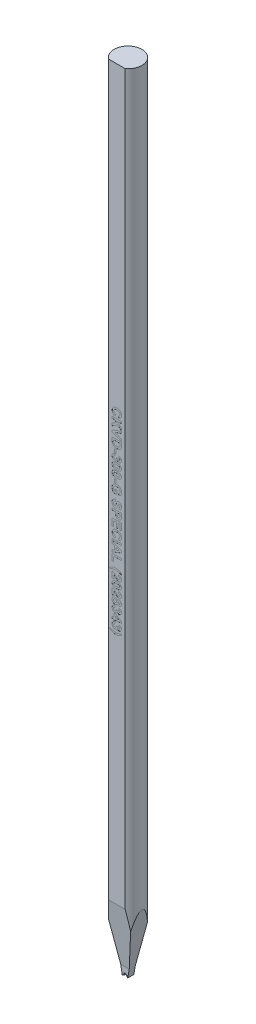
from build123d import *

# Parameters (mm, degrees)
SKETCH_TL_CUTTING_R       = 1.4986
TL_CUTTING_DEPTH          = 85.4964
SKETCH_TDF_GRINDING_W     = 3.0172
SKETCH_TDF_GRINDING_H     = 3.0172
TDF_GRINDING_DEPTH        = 86.522663762
SKETCH_ENGRAVING_W        = 0.166666667
SKETCH_ENGRAVING_H        = 0.371794872
SKETCH_ENGRAVING_W_2      = 1
SKETCH_ENGRAVING_H_2      = 0.192307693
ENGRAVING_DEPTH           = 0.005
VW_VR_GRINDING_DEPTH      = 1.5086
VW_VR_GRINDING_DEPTH_BACK = 1.5086
ISA_GRINDING_DEPTH        = 1.5086
ISA_GRINDING_DEPTH_BACK   = 1.5086
PRE_FRX_BRX_DEPTH         = 1.5086
PRE_FRX_BRX_DEPTH_BACK    = 1.5086
SKETCH_PRE_FRX_BRX_W      = 1.18348
SKETCH_PRE_FRX_BRX_H      = 0.89916
FR_EDM_R                  = 0.14986
BR_EDM_R                  = 0.14986
FA_BA_GRINDING_DEPTH      = 1.5086
FA_BA_GRINDING_DEPTH_BACK = 1.5086


with BuildPart() as part:
    # sketch_TL_cutting → TL_cutting (new body)
    with BuildSketch(Plane(origin=(0, 0, 0), x_dir=(1, 0, 0), z_dir=(0, 1, 0))):
        Circle(SKETCH_TL_CUTTING_R)
    extrude(amount=TL_CUTTING_DEPTH)

    # sketch_TDF_grinding → TDF_grinding (cut, through all)
    with BuildSketch(Plane(origin=(0, 0, 0), x_dir=(1, 0, 0), z_dir=(0, 1, 0))):
        with Locations((0, -2.71002)):
            Rectangle(SKETCH_TDF_GRINDING_W, SKETCH_TDF_GRINDING_H)
    extrude(amount=TDF_GRINDING_DEPTH, mode=Mode.SUBTRACT)

    # sketch_engraving → engraving (cut)
    # profile 1 of 26: a face of its own
    with BuildSketch(Plane.XY.offset(1.20142)):
        with BuildLine():
            Line((-0.128205128, 52.752810256), (-0.192307692, 52.560502564))
            add(Edge.make_bspline(
                [(-0.192307692, 52.560502564), (-0.204917923, 52.564409052), (-0.229612721, 52.572059184), (-0.2649877, 52.586137804), (-0.297871332, 52.602132008), (-0.328259475, 52.619959875), (-0.356049464, 52.639695258), (-0.381471598, 52.661189244), (-0.404368127, 52.684653424), (-0.424673345, 52.710070624), (-0.442633936, 52.737163711), (-0.457816548, 52.766256053), (-0.470893242, 52.79691117), (-0.481488041, 52.829440557), (-0.489972889, 52.863628151), (-0.495577171, 52.899634413), (-0.499377062, 52.937290896), (-0.499789062, 52.963003283), (-0.5, 52.976167628)],
                knots=[0, 0, 0, 0, 1.126670901, 2.206376047, 3.246533763, 4.245677351, 5.210506282, 6.152793389, 7.083980095, 8.004497442, 8.926231833, 9.854395169, 10.801995143, 11.768203916, 12.771938831, 13.805609698, 14.87650608, 16, 16, 16, 16], degree=3))
            add(Edge.make_bspline(
                [(-0.5, 52.976167628), (-0.499663994, 52.992416309), (-0.499003061, 53.024377949), (-0.492350465, 53.071119052), (-0.481969511, 53.115660328), (-0.467601869, 53.158069613), (-0.448555271, 53.198048786), (-0.42571373, 53.235973108), (-0.398318662, 53.271409391), (-0.367249987, 53.304550716), (-0.332452821, 53.334679196), (-0.294134751, 53.360672297), (-0.253074131, 53.383210491), (-0.208709772, 53.401136594), (-0.161353037, 53.415221791), (-0.110975156, 53.425068328), (-0.057578507, 53.431234942), (-0.020984357, 53.431937083), (-0.002203526, 53.432297436)],
                knots=[0, 0, 0, 0, 1.025134988, 2.016471176, 2.973446247, 3.909197306, 4.836872559, 5.763618465, 6.698581235, 7.658772073, 8.627106982, 9.597494692, 10.576422683, 11.578339294, 12.6118974, 13.690673505, 14.814808564, 16, 16, 16, 16], degree=3))
            add(Edge.make_bspline(
                [(-0.002203526, 53.432297436), (0.017576475, 53.4319292), (0.056163648, 53.431210839), (0.112313555, 53.425162878), (0.165084042, 53.415116768), (0.214577853, 53.401540058), (0.260470573, 53.383329249), (0.303160692, 53.361473909), (0.342311169, 53.335356152), (0.377833814, 53.305431091), (0.409480853, 53.272297852), (0.437377469, 53.236593428), (0.460593243, 53.198091041), (0.479896446, 53.157267336), (0.494630503, 53.113823397), (0.505304611, 53.067876602), (0.511505561, 53.019406054), (0.512376199, 52.98626808), (0.512820513, 52.969356731)],
                knots=[0, 0, 0, 0, 1.212773307, 2.365899439, 3.458117515, 4.504331001, 5.50806732, 6.480562534, 7.440239902, 8.387651817, 9.323121479, 10.245404239, 11.160468186, 12.07454208, 13.009500751, 13.96802424, 14.963018902, 16, 16, 16, 16], degree=3))
            add(Edge.make_bspline(
                [(0.512820513, 52.969356731), (0.512448361, 52.954587276), (0.511718707, 52.925629796), (0.506761415, 52.883224506), (0.498061698, 52.843036158), (0.486319015, 52.804847521), (0.470821797, 52.768875987), (0.451884357, 52.735057111), (0.429606892, 52.703274651), (0.412205553, 52.684125065), (0.403445513, 52.674484936)],
                knots=[0, 0, 0, 0, 1.098510076, 2.153775193, 3.169777012, 4.153122333, 5.120892526, 6.076995459, 7.031936742, 8, 8, 8, 8], degree=3))
            add(Edge.make_bspline(
                [(0.403445513, 52.674484936), (0.39787141, 52.668897644), (0.386592274, 52.657591818), (0.367549896, 52.642495368), (0.347050772, 52.628182058), (0.324745215, 52.614879068), (0.30046466, 52.603006849), (0.274581981, 52.591994097), (0.246997406, 52.581855069), (0.227800247, 52.576216604), (0.217948718, 52.573323077)],
                knots=[0, 0, 0, 0, 0.885292881, 1.791380647, 2.722937556, 3.69093542, 4.703306561, 5.754477758, 6.847650944, 8, 8, 8, 8], degree=3))
            Line((0.217948718, 52.573323077), (0.179487179, 52.765630769))
            add(Edge.make_bspline(
                [(0.179487179, 52.765630769), (0.1857949, 52.767265288), (0.198219456, 52.770484861), (0.21607256, 52.77699955), (0.233014714, 52.784471208), (0.248625569, 52.7937361), (0.263619506, 52.803562074), (0.277222328, 52.815224773), (0.290109132, 52.827729754), (0.301694454, 52.841618861), (0.312145605, 52.856493589), (0.321339918, 52.872203983), (0.329014435, 52.888788478), (0.335156827, 52.906121754), (0.340319842, 52.924145702), (0.34350638, 52.943032147), (0.345953545, 52.962615752), (0.3460861, 52.975958875), (0.346153846, 52.982778205)],
                knots=[0, 0, 0, 0, 1.051114734, 2.070420253, 3.064047898, 4.034553068, 4.997066449, 5.953344811, 6.921213386, 7.892675544, 8.867420182, 9.852654213, 10.826683617, 11.811917648, 12.818610352, 13.848120519, 14.900229319, 16, 16, 16, 16], degree=3))
            add(Edge.make_bspline(
                [(0.346153846, 52.982778205), (0.345958725, 52.992142256), (0.345576529, 53.01048423), (0.341532101, 53.03721448), (0.335695112, 53.062655692), (0.326982094, 53.08671706), (0.315677399, 53.109331698), (0.302244603, 53.130828905), (0.286035184, 53.150660806), (0.26758257, 53.169299764), (0.246135655, 53.186007721), (0.221779967, 53.200710652), (0.194212535, 53.212904121), (0.163711493, 53.222804409), (0.130202077, 53.230596736), (0.093641969, 53.236161162), (0.054005962, 53.239238434), (0.026581025, 53.239733903), (0.012419872, 53.239989744)],
                knots=[0, 0, 0, 0, 0.93816214, 1.837638998, 2.704791736, 3.551915875, 4.396257554, 5.235807848, 6.087970119, 6.959042444, 7.860386085, 8.80649345, 9.804409709, 10.875695391, 12.017327537, 13.250155505, 14.580089023, 16, 16, 16, 16], degree=3))
            add(Edge.make_bspline(
                [(0.012419872, 53.239989744), (-0.002609028, 53.239736423), (-0.031567402, 53.239248312), (-0.073337178, 53.236171685), (-0.111754322, 53.230571705), (-0.14688701, 53.222882849), (-0.178713725, 53.212932973), (-0.207179389, 53.200759106), (-0.23231734, 53.186286701), (-0.254110839, 53.169538275), (-0.272831387, 53.150937256), (-0.288926796, 53.130987439), (-0.302688307, 53.109806524), (-0.314010391, 53.087267053), (-0.322575422, 53.063283298), (-0.328786932, 53.038052371), (-0.332735688, 53.011481695), (-0.333131326, 52.993275799), (-0.333333333, 52.983980128)],
                knots=[0, 0, 0, 0, 1.475208372, 2.842499301, 4.107722225, 5.282836115, 6.369007568, 7.375918121, 8.315702116, 9.208439171, 10.065831443, 10.90006451, 11.71996243, 12.54067204, 13.369972975, 14.214060185, 15.088124569, 16, 16, 16, 16], degree=3))
            add(Edge.make_bspline(
                [(-0.333333333, 52.983980128), (-0.333161634, 52.977097953), (-0.332824013, 52.963565176), (-0.330681155, 52.943562689), (-0.326591822, 52.92436438), (-0.321184418, 52.905876281), (-0.314399721, 52.888026559), (-0.305696319, 52.87108748), (-0.295693052, 52.854725777), (-0.283969989, 52.83928094), (-0.270808612, 52.824546156), (-0.255597341, 52.811107159), (-0.238701667, 52.798641373), (-0.220008678, 52.787306947), (-0.199678377, 52.77672516), (-0.177394008, 52.767722121), (-0.153515697, 52.759334984), (-0.136789345, 52.755023153), (-0.128205128, 52.752810256)],
                knots=[0, 0, 0, 0, 0.980177776, 1.927374078, 2.859849964, 3.771585772, 4.668674471, 5.574490016, 6.479656464, 7.396337719, 8.332153134, 9.288470092, 10.28125149, 11.318486971, 12.398724812, 13.541284404, 14.738150009, 16, 16, 16, 16], degree=3))
        make_face()
    # profile 2 of 26: a face of its own
    with BuildSketch(Plane.XY.offset(1.20142)):
        Polygon((-0.5, 52.393835897), (0.5, 52.393835897), (0.5, 52.201528205), (0.052283654, 52.201528205), (0.5, 51.779853526), (0.5, 51.515630769), (0.11338141, 51.895438462), (-0.5, 51.502810256), (-0.5, 51.759020192), (-0.035456731, 52.041271795), (-0.198517628, 52.201528205), (-0.5, 52.201528205), align=None)
    # profile 3 of 26: a face of its own
    with BuildSketch(Plane.XY.offset(1.20142)):
        Polygon((-0.5, 51.126608333), (0.5, 51.4964), (0.5, 51.293275), (-0.243589744, 51.028451282), (0.5, 50.764629167), (0.5, 50.560502564), (-0.5, 50.928891987), align=None)
    # profile 4 of 26: a face of its own
    with BuildSketch(Plane.XY.offset(1.20142)):
        with BuildLine():
            Line((0.5, 50.470758974), (0.5, 50.103972115))
            add(Edge.make_bspline(
                [(0.5, 50.103972115), (0.500005193, 50.093954571), (0.500015306, 50.074448084), (0.498840892, 50.046139066), (0.497659587, 50.019666494), (0.495294873, 49.995106352), (0.492816233, 49.972373432), (0.489678088, 49.951426942), (0.485656212, 49.932399202), (0.482484481, 49.920400319), (0.480969551, 49.914669231)],
                knots=[0, 0, 0, 0, 1.259756885, 2.453039283, 3.563158368, 4.591894114, 5.55549294, 6.43918076, 7.254497783, 8, 8, 8, 8], degree=3))
            add(Edge.make_bspline(
                [(0.480969551, 49.914669231), (0.478637325, 49.907500254), (0.474014881, 49.893291431), (0.465827813, 49.872438378), (0.455960096, 49.852604479), (0.445111978, 49.833329819), (0.432903728, 49.815057553), (0.419595761, 49.797342873), (0.404753223, 49.780709803), (0.383633179, 49.75917514), (0.35420815, 49.734750255), (0.315375005, 49.70891972), (0.272594656, 49.687182014), (0.234409605, 49.671990641), (0.20183843, 49.661946542), (0.175754603, 49.655378141), (0.148301213, 49.649706468), (0.119383738, 49.645456292), (0.08913491, 49.641794906), (0.057465542, 49.639167238), (0.024383276, 49.63786625), (0.001870575, 49.637574494), (-0.009615385, 49.637425641)],
                knots=[0, 0, 0, 0, 0.745431882, 1.477436776, 2.212739876, 2.934276521, 3.663147754, 4.384200836, 5.123377481, 5.865761747, 7.365547505, 8.894711587, 10.468722596, 12.101948761, 12.951987285, 13.837595333, 14.760899389, 15.722756883, 16.726861385, 17.773652936, 18.864119771, 20, 20, 20, 20], degree=3))
            add(Edge.make_bspline(
                [(-0.009615385, 49.637425641), (-0.0294616, 49.637817046), (-0.067834928, 49.63857384), (-0.123301552, 49.644171211), (-0.17465514, 49.653466648), (-0.206804138, 49.663177075), (-0.222355769, 49.667874359)],
                knots=[0, 0, 0, 0, 1.103491527, 2.133638164, 3.0971734, 4, 4, 4, 4], degree=3))
            add(Edge.make_bspline(
                [(-0.222355769, 49.667874359), (-0.231274521, 49.671048003), (-0.248819098, 49.677291057), (-0.274127236, 49.688215932), (-0.298211673, 49.700020337), (-0.321053432, 49.712802184), (-0.342549771, 49.726626052), (-0.362636394, 49.741543645), (-0.381577746, 49.757323731), (-0.393236239, 49.76875549), (-0.399038462, 49.774444872)],
                knots=[0, 0, 0, 0, 1.090884612, 2.145940218, 3.175104604, 4.181306866, 5.161203701, 6.118658341, 7.063689906, 8, 8, 8, 8], degree=3))
            add(Edge.make_bspline(
                [(-0.399038462, 49.774444872), (-0.407300305, 49.783731145), (-0.424264154, 49.802798431), (-0.445652736, 49.83614995), (-0.464086504, 49.874025276), (-0.473760833, 49.901339168), (-0.478766026, 49.915470513)],
                knots=[0, 0, 0, 0, 0.912008655, 1.872605891, 2.89935344, 4, 4, 4, 4], degree=3))
            add(Edge.make_bspline(
                [(-0.478766026, 49.915470513), (-0.4805228, 49.921190486), (-0.484168894, 49.933061996), (-0.488062998, 49.951885444), (-0.492165475, 49.971979947), (-0.49463687, 49.993577223), (-0.497243066, 50.016453081), (-0.498706299, 50.040789822), (-0.49974511, 50.066503081), (-0.499913777, 50.084139175), (-0.5, 50.093154808)],
                knots=[0, 0, 0, 0, 0.799129865, 1.658552685, 2.566799617, 3.538529252, 4.561352959, 5.643373779, 6.795284424, 8, 8, 8, 8], degree=3))
            Line((-0.5, 50.093154808), (-0.5, 50.470758974))
            Line((-0.5, 50.470758974), (0.5, 50.470758974))
        make_face()
        with BuildLine():
            Line((0.333333333, 50.278451282), (-0.333333333, 50.278451282))
            Line((-0.333333333, 50.278451282), (-0.333333333, 50.120198077))
            add(Edge.make_bspline(
                [(-0.333333333, 50.120198077), (-0.333276671, 50.11305336), (-0.333167574, 50.099297049), (-0.332847006, 50.079391316), (-0.331979167, 50.061098115), (-0.331080228, 50.044321614), (-0.329595022, 50.02910549), (-0.328134266, 50.015383535), (-0.326090699, 50.003232132), (-0.324477534, 49.995727127), (-0.323717949, 49.992193269)],
                knots=[0, 0, 0, 0, 1.333384787, 2.567275092, 3.714769766, 4.750907381, 5.701951617, 6.567520054, 7.325492842, 8, 8, 8, 8], degree=3))
            add(Edge.make_bspline(
                [(-0.323717949, 49.992193269), (-0.321509316, 49.983916575), (-0.317207482, 49.967795757), (-0.307617456, 49.945160499), (-0.296048139, 49.924678507), (-0.282136533, 49.90600677), (-0.26455548, 49.88917967), (-0.242070693, 49.874815683), (-0.215254411, 49.861522192), (-0.189584523, 49.852418806), (-0.16665678, 49.845884413), (-0.147412959, 49.841461165), (-0.126593091, 49.837965591), (-0.104279343, 49.834958942), (-0.080500412, 49.832529499), (-0.055170426, 49.831017784), (-0.028320392, 49.829986029), (-0.009883527, 49.829819161), (-0.000400641, 49.829733333)],
                knots=[0, 0, 0, 0, 1.038686998, 2.023088296, 2.974059649, 3.888265163, 4.839857954, 5.909819677, 7.113156087, 8.466843969, 9.20827164, 10.006482943, 10.861893492, 11.769681931, 12.739021491, 13.762258324, 14.849031541, 16, 16, 16, 16], degree=3))
            add(Edge.make_bspline(
                [(-0.000400641, 49.829733333), (0.009082275, 49.8298185), (0.027452469, 49.829983485), (0.054102292, 49.831013664), (0.079033415, 49.832516863), (0.102276578, 49.834963691), (0.123864169, 49.837923456), (0.143813574, 49.841460891), (0.161996804, 49.845854423), (0.183589283, 49.852407511), (0.207947697, 49.862244996), (0.23429421, 49.876071199), (0.2571147, 49.892336402), (0.276689574, 49.910691558), (0.29287817, 49.931778569), (0.306422028, 49.955149371), (0.316938162, 49.981280279), (0.321416742, 49.999869318), (0.323717949, 50.009420833)],
                knots=[0, 0, 0, 0, 1.118059345, 2.165891593, 3.144157881, 4.062285166, 4.920717571, 5.712910489, 6.449981617, 7.12489426, 8.371943983, 9.541298068, 10.624898781, 11.666293176, 12.69306237, 13.747704633, 14.842713931, 16, 16, 16, 16], degree=3))
            add(Edge.make_bspline(
                [(0.323717949, 50.009420833), (0.324486218, 50.013555143), (0.326177652, 50.022657311), (0.328151987, 50.037761571), (0.329628909, 50.055548179), (0.331099472, 50.075977116), (0.331977905, 50.099027064), (0.332859431, 50.124732571), (0.333166326, 50.153116851), (0.333276065, 50.172949207), (0.333333333, 50.183299038)],
                knots=[0, 0, 0, 0, 0.578739524, 1.274162912, 2.095457587, 3.035141998, 4.093102578, 5.270121571, 6.575369351, 8, 8, 8, 8], degree=3))
            Line((0.333333333, 50.183299038), (0.333333333, 50.278451282))
        make_face(mode=Mode.SUBTRACT)
    # profile 5 of 26: a face of its own
    with BuildSketch(Plane.XY.offset(1.20142)):
        with Locations((-0.147435898, 49.310502564)):
            Rectangle(SKETCH_ENGRAVING_W, SKETCH_ENGRAVING_H)
    # profile 6 of 26: a face of its own
    with BuildSketch(Plane.XY.offset(1.20142)):
        with BuildLine():
            Line((-0.215945513, 49.060502564), (-0.192307692, 48.868194872))
            add(Edge.make_bspline(
                [(-0.192307692, 48.868194872), (-0.204132194, 48.866534047), (-0.226576764, 48.863381568), (-0.25764429, 48.853552911), (-0.284674848, 48.840719233), (-0.306838708, 48.823737778), (-0.324372016, 48.80411589), (-0.33711688, 48.78229994), (-0.34490548, 48.758267347), (-0.345732378, 48.741516439), (-0.346153846, 48.732978526)],
                knots=[0, 0, 0, 0, 1.266221457, 2.403466716, 3.446976871, 4.428566981, 5.347951143, 6.225000641, 7.095285456, 8, 8, 8, 8], degree=3))
            add(Edge.make_bspline(
                [(-0.346153846, 48.732978526), (-0.346055611, 48.728363461), (-0.345861023, 48.719221738), (-0.343788926, 48.705789506), (-0.340465357, 48.692918943), (-0.335437029, 48.680731108), (-0.329556159, 48.668986661), (-0.32227181, 48.657736899), (-0.313281658, 48.647422443), (-0.303428531, 48.637359798), (-0.292217285, 48.628428114), (-0.280052259, 48.620560902), (-0.267055651, 48.613654907), (-0.252891939, 48.608302089), (-0.237868043, 48.604112024), (-0.221918716, 48.601116531), (-0.205104086, 48.599293476), (-0.193581061, 48.599075398), (-0.187700321, 48.598964103)],
                knots=[0, 0, 0, 0, 0.951793398, 1.885354025, 2.797928458, 3.688489604, 4.600647717, 5.506538063, 6.445271935, 7.419741996, 8.409776722, 9.395967385, 10.406883209, 11.440832221, 12.514165763, 13.622322902, 14.786559767, 16, 16, 16, 16], degree=3))
            add(Edge.make_bspline(
                [(-0.187700321, 48.598964103), (-0.176786947, 48.599382422), (-0.155968497, 48.600180413), (-0.126418152, 48.606306809), (-0.100528778, 48.617013017), (-0.078485293, 48.631691647), (-0.060832569, 48.649480913), (-0.047691388, 48.669490944), (-0.040013472, 48.691714606), (-0.038982665, 48.707147528), (-0.038461538, 48.714949679)],
                knots=[0, 0, 0, 0, 1.241181749, 2.367689556, 3.413199457, 4.409869786, 5.360751057, 6.245864667, 7.113192516, 8, 8, 8, 8], degree=3))
            add(Edge.make_bspline(
                [(-0.038461538, 48.714949679), (-0.038603641, 48.720503112), (-0.038904883, 48.732275803), (-0.04203482, 48.750587586), (-0.046354275, 48.770556665), (-0.050509304, 48.78415409), (-0.052684295, 48.791271795)],
                knots=[0, 0, 0, 0, 0.854525515, 1.811503923, 2.854410343, 4, 4, 4, 4], degree=3))
            Line((-0.052684295, 48.791271795), (0.102564103, 48.773242949))
            add(Edge.make_bspline(
                [(0.102564103, 48.773242949), (0.102472429, 48.767898846), (0.102294537, 48.757528639), (0.103550083, 48.742385032), (0.10584242, 48.72821013), (0.10956176, 48.715037094), (0.114073964, 48.702853353), (0.119743619, 48.69155343), (0.126797738, 48.681409885), (0.137452935, 48.669074156), (0.153346669, 48.656372172), (0.175381237, 48.645319273), (0.200195104, 48.638563806), (0.217704887, 48.637813684), (0.226762821, 48.637425641)],
                knots=[0, 0, 0, 0, 0.916921599, 1.779281976, 2.604591006, 3.377627834, 4.124827521, 4.832199257, 5.541147775, 6.239830602, 7.625300353, 8.999010263, 10.447566839, 12, 12, 12, 12], degree=3))
            add(Edge.make_bspline(
                [(0.226762821, 48.637425641), (0.234476764, 48.637676334), (0.249283176, 48.638157523), (0.270180788, 48.643395916), (0.288882255, 48.651270608), (0.304586758, 48.662898575), (0.317487731, 48.677054609), (0.326781862, 48.693694939), (0.332438867, 48.712588834), (0.333026806, 48.725859453), (0.333333333, 48.732778205)],
                knots=[0, 0, 0, 0, 1.147344735, 2.202253707, 3.191599761, 4.153119954, 5.090433954, 6.026214277, 6.97094964, 8, 8, 8, 8], degree=3))
            add(Edge.make_bspline(
                [(0.333333333, 48.732778205), (0.332987648, 48.739708214), (0.332308151, 48.753330209), (0.325708071, 48.772798134), (0.315274673, 48.790641507), (0.300599014, 48.806510612), (0.282168696, 48.820209405), (0.259890756, 48.831166627), (0.233746812, 48.838598565), (0.214986903, 48.841191309), (0.205128205, 48.842553846)],
                knots=[0, 0, 0, 0, 0.89036141, 1.750142028, 2.61780756, 3.537452052, 4.514848764, 5.561443886, 6.71849122, 8, 8, 8, 8], degree=3))
            Line((0.205128205, 48.842553846), (0.233974359, 49.034861538))
            add(Edge.make_bspline(
                [(0.233974359, 49.034861538), (0.248657574, 49.031692323), (0.276764536, 49.025625734), (0.316129698, 49.013201503), (0.350961973, 48.998711687), (0.381387831, 48.981441655), (0.408215463, 48.961335814), (0.431647434, 48.93761335), (0.452006068, 48.91028244), (0.469141566, 48.879607941), (0.48286138, 48.846238807), (0.493019554, 48.810730657), (0.49884023, 48.773168376), (0.49960808, 48.747488246), (0.5, 48.734380769)],
                knots=[0, 0, 0, 0, 1.22092895, 2.337131514, 3.351677773, 4.283094182, 5.174661873, 6.069250129, 6.984703325, 7.937694494, 8.918809374, 9.912257166, 10.934388599, 12, 12, 12, 12], degree=3))
            add(Edge.make_bspline(
                [(0.5, 48.734380769), (0.499743324, 48.7232156), (0.499240363, 48.701337211), (0.494922998, 48.669342302), (0.487994845, 48.638986892), (0.478138042, 48.610372682), (0.465473847, 48.583430657), (0.449646388, 48.558407035), (0.431514029, 48.53466228), (0.417247021, 48.520676666), (0.41005609, 48.513627564)],
                knots=[0, 0, 0, 0, 1.090586174, 2.137027055, 3.148380755, 4.128502444, 5.088724121, 6.050075692, 7.017189, 8, 8, 8, 8], degree=3))
            add(Edge.make_bspline(
                [(0.41005609, 48.513627564), (0.403937931, 48.508174347), (0.391853934, 48.497403677), (0.372464834, 48.483452563), (0.352400741, 48.471665213), (0.33177098, 48.462111955), (0.310637907, 48.454351566), (0.288816497, 48.448944728), (0.26639464, 48.445649626), (0.251213033, 48.445295679), (0.243589744, 48.445117949)],
                knots=[0, 0, 0, 0, 1.065686435, 2.104841259, 3.101590809, 4.088754543, 5.058798532, 6.025881737, 7.008716709, 8, 8, 8, 8], degree=3))
            add(Edge.make_bspline(
                [(0.243589744, 48.445117949), (0.232867144, 48.445508156), (0.211730927, 48.446277325), (0.180999661, 48.45338324), (0.151856431, 48.4647029), (0.124562561, 48.480757174), (0.09868881, 48.500990588), (0.075169415, 48.526316452), (0.052695262, 48.555562269), (0.04001359, 48.577565891), (0.033453526, 48.588948077)],
                knots=[0, 0, 0, 0, 0.957658001, 1.887720032, 2.804751961, 3.743912922, 4.709136476, 5.731252806, 6.826406682, 8, 8, 8, 8], degree=3))
            add(Edge.make_bspline(
                [(0.033453526, 48.588948077), (0.031822372, 48.582175609), (0.028603533, 48.568811152), (0.022022537, 48.549514744), (0.01367829, 48.531457672), (0.004232675, 48.514275623), (-0.006542103, 48.498065765), (-0.018789165, 48.482873779), (-0.032819972, 48.469156037), (-0.047679673, 48.456052996), (-0.063887586, 48.444503284), (-0.081022983, 48.434471663), (-0.098866636, 48.425786197), (-0.117582182, 48.418774095), (-0.137087229, 48.413333972), (-0.157475267, 48.409606248), (-0.178623511, 48.407093745), (-0.193034825, 48.406803264), (-0.200320513, 48.40665641)],
                knots=[0, 0, 0, 0, 1.03751577, 2.047382676, 3.031239205, 3.997486026, 4.965932412, 5.927662117, 6.898405035, 7.88572577, 8.876798211, 9.857834218, 10.841137353, 11.829660183, 12.831310853, 13.853692922, 14.91492721, 16, 16, 16, 16], degree=3))
            add(Edge.make_bspline(
                [(-0.200320513, 48.40665641), (-0.2109584, 48.406872661), (-0.231937745, 48.407299137), (-0.2626715, 48.412274881), (-0.292387684, 48.419227328), (-0.320688592, 48.429885264), (-0.348018602, 48.443044593), (-0.373770643, 48.459712865), (-0.398719241, 48.478775045), (-0.421838487, 48.500951285), (-0.443209677, 48.52508231), (-0.461662849, 48.551183574), (-0.477734226, 48.578462651), (-0.490419897, 48.607447217), (-0.500667813, 48.637701873), (-0.507459472, 48.669576996), (-0.512114414, 48.702793455), (-0.512582989, 48.725483302), (-0.512820513, 48.736984936)],
                knots=[0, 0, 0, 0, 1.00633359, 1.984625146, 2.941575753, 3.891818189, 4.841976474, 5.80848851, 6.791183869, 7.810935832, 8.837000052, 9.838854168, 10.83333837, 11.829730352, 12.829487178, 13.852742075, 14.911540725, 16, 16, 16, 16], degree=3))
            add(Edge.make_bspline(
                [(-0.512820513, 48.736984936), (-0.512637793, 48.747883744), (-0.51227889, 48.76929157), (-0.508027091, 48.800630842), (-0.501772194, 48.830646869), (-0.492621954, 48.85916445), (-0.481351422, 48.886431997), (-0.466822586, 48.911934845), (-0.450309361, 48.936329476), (-0.430965435, 48.958818893), (-0.409882535, 48.979729186), (-0.386697234, 48.998096375), (-0.362149526, 49.014463988), (-0.336021778, 49.028541702), (-0.308246096, 49.040211545), (-0.278894175, 49.049298132), (-0.248055897, 49.05654486), (-0.226796469, 49.05916515), (-0.215945513, 49.060502564)],
                knots=[0, 0, 0, 0, 1.077528213, 2.11651914, 3.123276654, 4.10732375, 5.075386463, 6.036572488, 7.005896639, 7.98540975, 8.966414275, 9.939311093, 10.906719916, 11.882103104, 12.870994428, 13.882228509, 14.919075059, 16, 16, 16, 16], degree=3))
        make_face()
    # profile 7 of 26: a face of its own
    with BuildSketch(Plane.XY.offset(1.20142)):
        with BuildLine():
            add(Edge.make_bspline(
                [(0.5, 47.964348718), (0.49971384, 47.952444998), (0.499156721, 47.929269821), (0.494192381, 47.895507508), (0.486315205, 47.863754925), (0.474936732, 47.834005943), (0.460535804, 47.806109267), (0.442472771, 47.780457415), (0.421624591, 47.75645643), (0.405435577, 47.742600797), (0.397235577, 47.735582692)],
                knots=[0, 0, 0, 0, 1.098626248, 2.138899374, 3.143835643, 4.113754749, 5.073488057, 6.034745239, 7.004566348, 8, 8, 8, 8], degree=3))
            add(Edge.make_bspline(
                [(0.397235577, 47.735582692), (0.392013767, 47.731567993), (0.381356969, 47.723374695), (0.364136726, 47.71234029), (0.345869985, 47.701731685), (0.326116385, 47.692473442), (0.305221356, 47.683600078), (0.283126793, 47.675409313), (0.259707844, 47.66817695), (0.235071142, 47.661872124), (0.209179241, 47.655978627), (0.181968999, 47.651041398), (0.15350924, 47.646815972), (0.123831018, 47.643520738), (0.092992495, 47.640566339), (0.060842825, 47.638949757), (0.027454838, 47.637625267), (0.004742429, 47.637492949), (-0.006810897, 47.637425641)],
                knots=[0, 0, 0, 0, 0.746775751, 1.524038446, 2.317840886, 3.141016509, 3.996283186, 4.892488336, 5.812382473, 6.774967264, 7.776368117, 8.823659909, 9.910833035, 11.039122168, 12.210293276, 13.424012874, 14.68964937, 16, 16, 16, 16], degree=3))
            add(Edge.make_bspline(
                [(-0.006810897, 47.637425641), (-0.01836425, 47.637491934), (-0.041009977, 47.637621876), (-0.074330982, 47.638954693), (-0.106413621, 47.640567781), (-0.13725379, 47.643513853), (-0.166926114, 47.646840728), (-0.195353975, 47.650946272), (-0.22243919, 47.656264764), (-0.248289812, 47.662071418), (-0.27303117, 47.668336077), (-0.296407841, 47.6758899), (-0.318777777, 47.683750303), (-0.339699687, 47.692829898), (-0.359477735, 47.702420372), (-0.377930928, 47.712871112), (-0.395257891, 47.724028726), (-0.40597091, 47.732301289), (-0.411258013, 47.736383974)],
                knots=[0, 0, 0, 0, 1.308411734, 2.564617834, 3.776541518, 4.94597967, 6.0725993, 7.15816376, 8.197872509, 9.197791611, 10.158952087, 11.086962723, 11.979249638, 12.843171697, 13.668427753, 14.467630577, 15.243743175, 16, 16, 16, 16], degree=3))
            add(Edge.make_bspline(
                [(-0.411258013, 47.736383974), (-0.419387722, 47.743337875), (-0.435436162, 47.757065209), (-0.456111536, 47.780800465), (-0.473801555, 47.8064109), (-0.487914093, 47.834257064), (-0.499368982, 47.863861236), (-0.506993451, 47.895665546), (-0.511967929, 47.929335616), (-0.512532265, 47.952511213), (-0.512820513, 47.964348718)],
                knots=[0, 0, 0, 0, 0.991667276, 1.957599061, 2.911530233, 3.873218945, 4.847995157, 5.850445929, 6.902062539, 8, 8, 8, 8], degree=3))
            add(Edge.make_bspline(
                [(-0.512820513, 47.964348718), (-0.512476011, 47.976321133), (-0.511800941, 47.999781702), (-0.506449472, 48.034035149), (-0.497876451, 48.066594622), (-0.485636462, 48.097343234), (-0.469774335, 48.126236989), (-0.45076002, 48.153501616), (-0.427732542, 48.178543948), (-0.40629523, 48.198149361), (-0.386925042, 48.212492741), (-0.37086259, 48.222609036), (-0.353675124, 48.232385358), (-0.33482528, 48.240823499), (-0.314870578, 48.249148475), (-0.293380967, 48.256521787), (-0.270541238, 48.263026959), (-0.246455682, 48.269134901), (-0.220958398, 48.274228025), (-0.194124629, 48.278912952), (-0.165840258, 48.282604927), (-0.136262825, 48.285878243), (-0.105322509, 48.288182844), (-0.073069943, 48.290054475), (-0.039401887, 48.290992969), (-0.01649349, 48.291177608), (-0.004807692, 48.291271795)],
                knots=[0, 0, 0, 0, 1.257818097, 2.464759732, 3.634271214, 4.790227596, 5.933394726, 7.09190477, 8.274482889, 9.50191983, 10.139172818, 10.805000628, 11.49619854, 12.215266328, 12.973768034, 13.768328009, 14.601232062, 15.469317089, 16.379095881, 17.333267023, 18.331755967, 19.376479622, 20.460535752, 21.592206075, 22.771760786, 24, 24, 24, 24], degree=3))
            add(Edge.make_bspline(
                [(-0.004807692, 48.291271795), (0.006678925, 48.291206), (0.02919122, 48.291077052), (0.062378132, 48.289734948), (0.094328674, 48.288141634), (0.12509981, 48.28516902), (0.154640959, 48.281869515), (0.183004063, 48.277756894), (0.209982531, 48.272338814), (0.235876189, 48.266989743), (0.260431507, 48.260249782), (0.2837906, 48.252824475), (0.306110518, 48.244990136), (0.326924245, 48.235817854), (0.346659803, 48.226282898), (0.365109758, 48.215824838), (0.382437536, 48.204669066), (0.39315045, 48.196396265), (0.3984375, 48.192313462)],
                knots=[0, 0, 0, 0, 1.304443357, 2.556541329, 3.771813033, 4.936929721, 6.066661712, 7.147723817, 8.190304831, 9.191350322, 10.149780912, 11.080355239, 11.975107155, 12.834450748, 13.66198663, 14.463397305, 15.241653965, 16, 16, 16, 16], degree=3))
            add(Edge.make_bspline(
                [(0.3984375, 48.192313462), (0.406566428, 48.185359179), (0.422613323, 48.171631089), (0.443299998, 48.147901361), (0.460913987, 48.122319209), (0.475197493, 48.094554301), (0.486497465, 48.064882107), (0.494183265, 48.033036121), (0.499144648, 47.999360686), (0.499710816, 47.976185839), (0.5, 47.964348718)],
                knots=[0, 0, 0, 0, 0.991631672, 1.957528776, 2.911425699, 3.867574088, 4.848108326, 5.850523106, 6.902101959, 8, 8, 8, 8], degree=3))
        make_face()
        with BuildLine():
            add(Edge.make_bspline(
                [(0.333333333, 47.964348718), (0.333068079, 47.970516684), (0.332548986, 47.982587158), (0.328316127, 48.000142094), (0.321759633, 48.016723165), (0.312130705, 48.032281206), (0.299093083, 48.04668978), (0.281476094, 48.058897658), (0.259881539, 48.069451162), (0.243736, 48.074730771), (0.235176282, 48.077529808)],
                knots=[0, 0, 0, 0, 0.909107913, 1.77908945, 2.650019014, 3.530482969, 4.465025013, 5.495890128, 6.672421267, 8, 8, 8, 8], degree=3))
            add(Edge.make_bspline(
                [(0.235176282, 48.077529808), (0.228718042, 48.079277997), (0.214837576, 48.083035317), (0.192206647, 48.08729972), (0.166522939, 48.090816485), (0.137792419, 48.093786038), (0.105999886, 48.096202628), (0.071125109, 48.097690848), (0.033192525, 48.098719478), (0.006878451, 48.098880391), (-0.006810897, 48.098964103)],
                knots=[0, 0, 0, 0, 0.658986521, 1.416336438, 2.266694271, 3.212608458, 4.261595115, 5.407496572, 6.651304179, 8, 8, 8, 8], degree=3))
            add(Edge.make_bspline(
                [(-0.006810897, 48.098964103), (-0.020433943, 48.098973117), (-0.046549094, 48.098990397), (-0.084006477, 48.097816163), (-0.118154033, 48.09664872), (-0.148991056, 48.094279061), (-0.176626244, 48.091940892), (-0.200847568, 48.088403343), (-0.221857789, 48.084850608), (-0.244486895, 48.078817153), (-0.268257705, 48.070501394), (-0.292448985, 48.059272977), (-0.311537375, 48.046607058), (-0.325415776, 48.032075587), (-0.334597404, 48.016330329), (-0.341538269, 48.000026395), (-0.345246665, 47.982474555), (-0.345848983, 47.970440013), (-0.346153846, 47.964348718)],
                knots=[0, 0, 0, 0, 1.613038927, 3.092168624, 4.43749063, 5.658264602, 6.75425577, 7.720394221, 8.556328411, 9.275513998, 10.490872946, 11.534172084, 12.42681833, 13.187531851, 13.88996177, 14.574222125, 15.278341114, 16, 16, 16, 16], degree=3))
            add(Edge.make_bspline(
                [(-0.346153846, 47.964348718), (-0.345874419, 47.95825088), (-0.345321688, 47.946188799), (-0.341225408, 47.928656833), (-0.334465655, 47.912099336), (-0.325029126, 47.896436493), (-0.311901617, 47.88201441), (-0.294300445, 47.869797614), (-0.272700888, 47.85924693), (-0.25655611, 47.853966893), (-0.247996795, 47.851167628)],
                knots=[0, 0, 0, 0, 0.899391665, 1.779078861, 2.640979247, 3.529945348, 4.464599804, 5.495588918, 6.672261578, 8, 8, 8, 8], degree=3))
            add(Edge.make_bspline(
                [(-0.247996795, 47.851167628), (-0.241538043, 47.849421968), (-0.227719754, 47.845687186), (-0.205229709, 47.841392396), (-0.179679092, 47.83786611), (-0.151079269, 47.834924791), (-0.11935541, 47.832484431), (-0.084546407, 47.831008845), (-0.046680798, 47.829979247), (-0.020433482, 47.829817356), (-0.006810897, 47.829733333)],
                knots=[0, 0, 0, 0, 0.66114423, 1.414496391, 2.261103113, 3.210114492, 4.255954433, 5.405607896, 6.653488082, 8, 8, 8, 8], degree=3))
            add(Edge.make_bspline(
                [(-0.006810897, 47.829733333), (0.006810741, 47.829847109), (0.032921137, 47.830065199), (0.070464093, 47.830692091), (0.104645163, 47.832447006), (0.13553417, 47.834203226), (0.163028833, 47.837168631), (0.187277888, 47.840111537), (0.208178651, 47.844183667), (0.23096624, 47.849775697), (0.254848985, 47.85811368), (0.278913284, 47.86968584), (0.298191428, 47.88212291), (0.312146257, 47.896629879), (0.321683592, 47.912348044), (0.328364426, 47.928800374), (0.332523972, 47.946249531), (0.333060584, 47.95824941), (0.333333333, 47.964348718)],
                knots=[0, 0, 0, 0, 1.611458614, 3.088895909, 4.441089836, 5.660086535, 6.747875232, 7.711965119, 8.548505902, 9.26500436, 10.486583113, 11.532259092, 12.419544583, 13.184925779, 13.890764661, 14.581638641, 15.279074115, 16, 16, 16, 16], degree=3))
        make_face(mode=Mode.SUBTRACT)
    # profile 8 of 26: a face of its own
    with BuildSketch(Plane.XY.offset(1.20142)):
        with BuildLine():
            add(Edge.make_bspline(
                [(0.5, 47.195117949), (0.49971384, 47.183214229), (0.499156721, 47.160039051), (0.494192381, 47.126276739), (0.486315205, 47.094524156), (0.474936732, 47.064775173), (0.460535804, 47.036878497), (0.442472771, 47.011226646), (0.421624591, 46.987225661), (0.405435577, 46.973370028), (0.397235577, 46.966351923)],
                knots=[0, 0, 0, 0, 1.098626248, 2.138899374, 3.143835643, 4.113754749, 5.073488057, 6.034745239, 7.004566348, 8, 8, 8, 8], degree=3))
            add(Edge.make_bspline(
                [(0.397235577, 46.966351923), (0.392013767, 46.962337224), (0.381356969, 46.954143926), (0.364136726, 46.94310952), (0.345869985, 46.932500915), (0.326116385, 46.923242673), (0.305221356, 46.914369309), (0.283126793, 46.906178544), (0.259707844, 46.89894618), (0.235071142, 46.892641354), (0.209179241, 46.886747858), (0.181968999, 46.881810628), (0.15350924, 46.877585203), (0.123831018, 46.874289969), (0.092992495, 46.87133557), (0.060842825, 46.869718988), (0.027454838, 46.868394498), (0.004742429, 46.868262179), (-0.006810897, 46.868194872)],
                knots=[0, 0, 0, 0, 0.746775751, 1.524038446, 2.317840886, 3.141016509, 3.996283186, 4.892488336, 5.812382473, 6.774967264, 7.776368117, 8.823659909, 9.910833035, 11.039122168, 12.210293276, 13.424012874, 14.68964937, 16, 16, 16, 16], degree=3))
            add(Edge.make_bspline(
                [(-0.006810897, 46.868194872), (-0.01836425, 46.868261165), (-0.041009977, 46.868391107), (-0.074330982, 46.869723924), (-0.106413621, 46.871337012), (-0.13725379, 46.874283084), (-0.166926114, 46.877609959), (-0.195353975, 46.881715503), (-0.22243919, 46.887033995), (-0.248289812, 46.892840649), (-0.27303117, 46.899105308), (-0.296407841, 46.906659131), (-0.318777777, 46.914519533), (-0.339699687, 46.923599129), (-0.359477735, 46.933189602), (-0.377930928, 46.943640342), (-0.395257891, 46.954797957), (-0.40597091, 46.96307052), (-0.411258013, 46.967153205)],
                knots=[0, 0, 0, 0, 1.308411734, 2.564617834, 3.776541518, 4.94597967, 6.0725993, 7.15816376, 8.197872509, 9.197791611, 10.158952087, 11.086962723, 11.979249638, 12.843171697, 13.668427753, 14.467630577, 15.243743175, 16, 16, 16, 16], degree=3))
            add(Edge.make_bspline(
                [(-0.411258013, 46.967153205), (-0.419387722, 46.974107105), (-0.435436162, 46.98783444), (-0.456111536, 47.011569695), (-0.473801555, 47.037180131), (-0.487914093, 47.065026295), (-0.499368982, 47.094630467), (-0.506993451, 47.126434777), (-0.511967929, 47.160104847), (-0.512532265, 47.183280444), (-0.512820513, 47.195117949)],
                knots=[0, 0, 0, 0, 0.991667276, 1.957599061, 2.911530233, 3.873218945, 4.847995157, 5.850445929, 6.902062539, 8, 8, 8, 8], degree=3))
            add(Edge.make_bspline(
                [(-0.512820513, 47.195117949), (-0.512476011, 47.207090364), (-0.511800941, 47.230550933), (-0.506449472, 47.264804379), (-0.497876451, 47.297363853), (-0.485636462, 47.328112465), (-0.469774335, 47.35700622), (-0.45076002, 47.384270847), (-0.427732542, 47.409313179), (-0.40629523, 47.428918592), (-0.386925042, 47.443261971), (-0.37086259, 47.453378267), (-0.353675124, 47.463154589), (-0.33482528, 47.47159273), (-0.314870578, 47.479917706), (-0.293380967, 47.487291018), (-0.270541238, 47.49379619), (-0.246455682, 47.499904132), (-0.220958398, 47.504997256), (-0.194124629, 47.509682183), (-0.165840258, 47.513374157), (-0.136262825, 47.516647473), (-0.105322509, 47.518952075), (-0.073069943, 47.520823706), (-0.039401887, 47.5217622), (-0.01649349, 47.521946839), (-0.004807692, 47.522041026)],
                knots=[0, 0, 0, 0, 1.257818097, 2.464759732, 3.634271214, 4.790227596, 5.933394726, 7.09190477, 8.274482889, 9.50191983, 10.139172818, 10.805000628, 11.49619854, 12.215266328, 12.973768034, 13.768328009, 14.601232062, 15.469317089, 16.379095881, 17.333267023, 18.331755967, 19.376479622, 20.460535752, 21.592206075, 22.771760786, 24, 24, 24, 24], degree=3))
            add(Edge.make_bspline(
                [(-0.004807692, 47.522041026), (0.006678925, 47.521975231), (0.02919122, 47.521846282), (0.062378132, 47.520504179), (0.094328674, 47.518910865), (0.12509981, 47.515938251), (0.154640959, 47.512638746), (0.183004063, 47.508526125), (0.209982531, 47.503108045), (0.235876189, 47.497758974), (0.260431507, 47.491019013), (0.2837906, 47.483593706), (0.306110518, 47.475759367), (0.326924245, 47.466587084), (0.346659803, 47.457052128), (0.365109758, 47.446594069), (0.382437536, 47.435438297), (0.39315045, 47.427165495), (0.3984375, 47.423082692)],
                knots=[0, 0, 0, 0, 1.304443357, 2.556541329, 3.771813033, 4.936929721, 6.066661712, 7.147723817, 8.190304831, 9.191350322, 10.149780912, 11.080355239, 11.975107155, 12.834450748, 13.66198663, 14.463397305, 15.241653965, 16, 16, 16, 16], degree=3))
            add(Edge.make_bspline(
                [(0.3984375, 47.423082692), (0.406566428, 47.41612841), (0.422613323, 47.40240032), (0.443299998, 47.378670592), (0.460913987, 47.353088439), (0.475197493, 47.325323532), (0.486497465, 47.295651338), (0.494183265, 47.263805352), (0.499144648, 47.230129916), (0.499710816, 47.20695507), (0.5, 47.195117949)],
                knots=[0, 0, 0, 0, 0.991631672, 1.957528776, 2.911425699, 3.867574088, 4.848108326, 5.850523106, 6.902101959, 8, 8, 8, 8], degree=3))
        make_face()
        with BuildLine():
            add(Edge.make_bspline(
                [(0.333333333, 47.195117949), (0.333068079, 47.201285915), (0.332548986, 47.213356389), (0.328316127, 47.230911325), (0.321759633, 47.247492396), (0.312130705, 47.263050436), (0.299093083, 47.277459011), (0.281476094, 47.289666888), (0.259881539, 47.300220392), (0.243736, 47.305500001), (0.235176282, 47.308299038)],
                knots=[0, 0, 0, 0, 0.909107913, 1.77908945, 2.650019014, 3.530482969, 4.465025013, 5.495890128, 6.672421267, 8, 8, 8, 8], degree=3))
            add(Edge.make_bspline(
                [(0.235176282, 47.308299038), (0.228718042, 47.310047227), (0.214837576, 47.313804548), (0.192206647, 47.318068951), (0.166522939, 47.321585716), (0.137792419, 47.324555269), (0.105999886, 47.326971859), (0.071125109, 47.328460078), (0.033192525, 47.329488709), (0.006878451, 47.329649622), (-0.006810897, 47.329733333)],
                knots=[0, 0, 0, 0, 0.658986521, 1.416336438, 2.266694271, 3.212608458, 4.261595115, 5.407496572, 6.651304179, 8, 8, 8, 8], degree=3))
            add(Edge.make_bspline(
                [(-0.006810897, 47.329733333), (-0.020433943, 47.329742347), (-0.046549094, 47.329759627), (-0.084006477, 47.328585394), (-0.118154033, 47.327417951), (-0.148991056, 47.325048292), (-0.176626244, 47.322710123), (-0.200847568, 47.319172574), (-0.221857789, 47.315619839), (-0.244486895, 47.309586384), (-0.268257705, 47.301270625), (-0.292448985, 47.290042207), (-0.311537375, 47.277376289), (-0.325415776, 47.262844818), (-0.334597404, 47.24709956), (-0.341538269, 47.230795625), (-0.345246665, 47.213243786), (-0.345848983, 47.201209244), (-0.346153846, 47.195117949)],
                knots=[0, 0, 0, 0, 1.613038927, 3.092168624, 4.43749063, 5.658264602, 6.75425577, 7.720394221, 8.556328411, 9.275513998, 10.490872946, 11.534172084, 12.42681833, 13.187531851, 13.88996177, 14.574222125, 15.278341114, 16, 16, 16, 16], degree=3))
            add(Edge.make_bspline(
                [(-0.346153846, 47.195117949), (-0.345874419, 47.189020111), (-0.345321688, 47.17695803), (-0.341225408, 47.159426063), (-0.334465655, 47.142868567), (-0.325029126, 47.127205723), (-0.311901617, 47.112783641), (-0.294300445, 47.100566845), (-0.272700888, 47.090016161), (-0.25655611, 47.084736123), (-0.247996795, 47.081936859)],
                knots=[0, 0, 0, 0, 0.899391665, 1.779078861, 2.640979247, 3.529945348, 4.464599804, 5.495588918, 6.672261578, 8, 8, 8, 8], degree=3))
            add(Edge.make_bspline(
                [(-0.247996795, 47.081936859), (-0.241538043, 47.080191199), (-0.227719754, 47.076456417), (-0.205229709, 47.072161627), (-0.179679092, 47.06863534), (-0.151079269, 47.065694022), (-0.11935541, 47.063253662), (-0.084546407, 47.061778076), (-0.046680798, 47.060748478), (-0.020433482, 47.060586587), (-0.006810897, 47.060502564)],
                knots=[0, 0, 0, 0, 0.66114423, 1.414496391, 2.261103113, 3.210114492, 4.255954433, 5.405607896, 6.653488082, 8, 8, 8, 8], degree=3))
            add(Edge.make_bspline(
                [(-0.006810897, 47.060502564), (0.006810741, 47.06061634), (0.032921137, 47.06083443), (0.070464093, 47.061461322), (0.104645163, 47.063216237), (0.13553417, 47.064972457), (0.163028833, 47.067937861), (0.187277888, 47.070880768), (0.208178651, 47.074952897), (0.23096624, 47.080544928), (0.254848985, 47.08888291), (0.278913284, 47.100455071), (0.298191428, 47.112892141), (0.312146257, 47.12739911), (0.321683592, 47.143117274), (0.328364426, 47.159569605), (0.332523972, 47.177018762), (0.333060584, 47.189018641), (0.333333333, 47.195117949)],
                knots=[0, 0, 0, 0, 1.611458614, 3.088895909, 4.441089836, 5.660086535, 6.747875232, 7.711965119, 8.548505902, 9.26500436, 10.486583113, 11.532259092, 12.419544583, 13.184925779, 13.890764661, 14.581638641, 15.279074115, 16, 16, 16, 16], degree=3))
        make_face(mode=Mode.SUBTRACT)
    # profile 9 of 26: a face of its own
    with BuildSketch(Plane.XY.offset(1.20142)):
        with Locations((-0.147435898, 46.541271795)):
            Rectangle(SKETCH_ENGRAVING_W, SKETCH_ENGRAVING_H)
    # profile 10 of 26: a face of its own
    with BuildSketch(Plane.XY.offset(1.20142)):
        with BuildLine():
            Line((-0.128205128, 45.791271795), (0.038461538, 45.791271795))
            Line((0.038461538, 45.791271795), (0.038461538, 45.355374359))
            Line((0.038461538, 45.355374359), (-0.36338141, 45.355374359))
            add(Edge.make_bspline(
                [(-0.36338141, 45.355374359), (-0.368321434, 45.360860375), (-0.378419843, 45.3720749), (-0.392661125, 45.390372664), (-0.406257259, 45.410516779), (-0.4194836, 45.432385469), (-0.432233696, 45.456023992), (-0.444685123, 45.481338064), (-0.45671611, 45.508374391), (-0.471787381, 45.546607711), (-0.488186169, 45.59582183), (-0.502445448, 45.655987076), (-0.511191227, 45.716628267), (-0.512277771, 45.757189075), (-0.512820513, 45.777449679)],
                knots=[0, 0, 0, 0, 0.581799769, 1.189316438, 1.825828404, 2.496525428, 3.203088405, 3.942228803, 4.719818701, 5.534979611, 7.181138583, 8.803804008, 10.403462225, 12, 12, 12, 12], degree=3))
            add(Edge.make_bspline(
                [(-0.512820513, 45.777449679), (-0.512629241, 45.790142166), (-0.512252188, 45.815162831), (-0.509233571, 45.852101118), (-0.504017902, 45.887818224), (-0.496780719, 45.922250736), (-0.487836372, 45.955501646), (-0.476607913, 45.987454166), (-0.463065488, 46.018074068), (-0.447986133, 46.047590581), (-0.430657849, 46.075443177), (-0.411724289, 46.101687023), (-0.390891397, 46.126067404), (-0.36853351, 46.148796217), (-0.344060025, 46.169444803), (-0.318106216, 46.188526641), (-0.290219674, 46.205585038), (-0.260879177, 46.220911559), (-0.230317098, 46.234540942), (-0.198781008, 46.246043246), (-0.166726875, 46.256126922), (-0.134042675, 46.264414707), (-0.10062201, 46.270501654), (-0.066619552, 46.275233529), (-0.031822841, 46.277775004), (-0.008417054, 46.278224325), (0.003405449, 46.278451282)],
                knots=[0, 0, 0, 0, 1.124897971, 2.217508473, 3.282174662, 4.322209414, 5.334422951, 6.332119154, 7.320662553, 8.300074908, 9.267468154, 10.225199689, 11.165658754, 12.107290334, 13.047749399, 14.00069605, 14.959944213, 15.942088746, 16.933021067, 17.923599838, 18.915715637, 19.910475908, 20.909926025, 21.925232038, 22.952013513, 24, 24, 24, 24], degree=3))
            add(Edge.make_bspline(
                [(0.003405449, 46.278451282), (0.016165747, 46.278267383), (0.041321811, 46.277904838), (0.078501182, 46.274775194), (0.114594914, 46.269927239), (0.149519517, 46.262532247), (0.183523729, 46.253678796), (0.216299841, 46.242334109), (0.248180515, 46.229380661), (0.278688999, 46.214096543), (0.308028284, 46.197213971), (0.335510174, 46.1780304), (0.361403632, 46.1572108), (0.385591047, 46.134567968), (0.407627145, 46.109729007), (0.428063784, 46.083203308), (0.447146094, 46.05500846), (0.457908016, 46.034831736), (0.463341346, 46.024645192)],
                knots=[0, 0, 0, 0, 1.105132952, 2.178694671, 3.229818344, 4.257558797, 5.269123684, 6.27148554, 7.259679084, 8.247804916, 9.224967877, 10.189258471, 11.147685264, 12.101072275, 13.055511435, 14.02039165, 15.000562851, 16, 16, 16, 16], degree=3))
            add(Edge.make_bspline(
                [(0.463341346, 46.024645192), (0.467347168, 46.016557841), (0.475455657, 46.000187618), (0.485329628, 45.974114525), (0.494054347, 45.946746948), (0.500719187, 45.917765473), (0.506115234, 45.887478993), (0.510216979, 45.855737917), (0.512307439, 45.822483708), (0.512647258, 45.799821284), (0.512820513, 45.788266987)],
                knots=[0, 0, 0, 0, 0.887950456, 1.797368171, 2.741221183, 3.713797788, 4.722103116, 5.768966405, 6.862521341, 8, 8, 8, 8], degree=3))
            add(Edge.make_bspline(
                [(0.512820513, 45.788266987), (0.512598613, 45.773369487), (0.512167059, 45.744396604), (0.508571106, 45.70215631), (0.502373597, 45.662402674), (0.493837942, 45.625080334), (0.482863355, 45.590269697), (0.469371425, 45.558030687), (0.453633675, 45.528165429), (0.435019378, 45.501106485), (0.414494937, 45.476303918), (0.392035387, 45.453822449), (0.367607461, 45.433653031), (0.341334074, 45.415782318), (0.313106625, 45.400350967), (0.283182558, 45.387082952), (0.251334696, 45.376161769), (0.22921692, 45.370883803), (0.217948718, 45.368194872)],
                knots=[0, 0, 0, 0, 1.271135529, 2.472123572, 3.614091059, 4.701890498, 5.736279567, 6.724681829, 7.680621489, 8.611506429, 9.52200816, 10.424540711, 11.318996785, 12.221421405, 13.131851814, 14.060431888, 15.011860567, 16, 16, 16, 16], degree=3))
            Line((0.217948718, 45.368194872), (0.179487179, 45.560502564))
            add(Edge.make_bspline(
                [(0.179487179, 45.560502564), (0.185798707, 45.562405146), (0.198251232, 45.566158905), (0.216108293, 45.573465481), (0.232994438, 45.581783603), (0.248643132, 45.591610597), (0.263649233, 45.602048251), (0.277161531, 45.614318435), (0.290187329, 45.627225453), (0.301701762, 45.641716609), (0.312086782, 45.657155164), (0.321450083, 45.673376632), (0.329043783, 45.690744974), (0.335153652, 45.709017597), (0.340342569, 45.728105002), (0.343533767, 45.74825634), (0.345940549, 45.7692453), (0.346081986, 45.783585325), (0.346153846, 45.790871154)],
                knots=[0, 0, 0, 0, 1.027780279, 2.027791312, 3.006028774, 3.96000864, 4.908113241, 5.852721087, 6.802883308, 7.765918715, 8.733730415, 9.704005314, 10.683351261, 11.68471758, 12.707948499, 13.764514378, 14.864202456, 16, 16, 16, 16], degree=3))
            add(Edge.make_bspline(
                [(0.346153846, 45.790871154), (0.345859633, 45.801898511), (0.34528545, 45.823419337), (0.341538784, 45.854836876), (0.334873123, 45.884476442), (0.325679114, 45.91241554), (0.313877959, 45.938705391), (0.299029501, 45.962990737), (0.282012344, 45.98587627), (0.262039987, 46.006710747), (0.239645267, 46.02560525), (0.214561065, 46.041961822), (0.186868462, 46.055578599), (0.156706511, 46.066731515), (0.124073954, 46.075611616), (0.088855272, 46.081635764), (0.051104495, 46.085571833), (0.02505068, 46.085949093), (0.01161859, 46.08614359)],
                knots=[0, 0, 0, 0, 1.043810997, 2.037086103, 2.989314757, 3.91471467, 4.817033861, 5.710208705, 6.603920097, 7.511448416, 8.435617211, 9.371747005, 10.338444094, 11.350425613, 12.411431869, 13.5347293, 14.729025275, 16, 16, 16, 16], degree=3))
            add(Edge.make_bspline(
                [(0.01161859, 46.08614359), (-0.002813331, 46.085940916), (-0.03086261, 46.085547007), (-0.071503034, 46.081712106), (-0.109371212, 46.075413885), (-0.14440027, 46.066346527), (-0.176807311, 46.055039264), (-0.206438048, 46.041059735), (-0.233109204, 46.024251899), (-0.256980675, 46.005189064), (-0.278169336, 45.984152253), (-0.296147735, 45.961089293), (-0.31184176, 45.936831086), (-0.32420794, 45.910691286), (-0.33413508, 45.883142798), (-0.341078682, 45.853916769), (-0.345395871, 45.823118498), (-0.345897627, 45.802036945), (-0.346153846, 45.791271795)],
                knots=[0, 0, 0, 0, 1.31821493, 2.562027667, 3.72541598, 4.821825939, 5.863743127, 6.857000185, 7.808227391, 8.737146514, 9.643023621, 10.529087527, 11.404035307, 12.277173472, 13.164790074, 14.074766194, 15.016892606, 16, 16, 16, 16], degree=3))
            add(Edge.make_bspline(
                [(-0.346153846, 45.791271795), (-0.345850315, 45.780368504), (-0.34524035, 45.758457617), (-0.340086045, 45.725636537), (-0.332449955, 45.692636283), (-0.321065283, 45.660243933), (-0.307937779, 45.628857225), (-0.292687307, 45.599691024), (-0.276962331, 45.572298447), (-0.264654274, 45.555785969), (-0.258613782, 45.547682051)],
                knots=[0, 0, 0, 0, 0.993779204, 1.997065276, 3.023588959, 4.078879359, 5.123947549, 6.123456565, 7.079038607, 8, 8, 8, 8], degree=3))
            Line((-0.258613782, 45.547682051), (-0.128205128, 45.547682051))
            Line((-0.128205128, 45.547682051), (-0.128205128, 45.791271795))
        make_face()
    # profile 11 of 26: a face of its own
    with BuildSketch(Plane.XY.offset(1.20142)):
        with BuildLine():
            Line((-0.166666667, 44.829733333), (-0.153846154, 44.637425641))
            add(Edge.make_bspline(
                [(-0.153846154, 44.637425641), (-0.161891279, 44.635892992), (-0.177518424, 44.632915918), (-0.199795017, 44.626312009), (-0.220541784, 44.619005841), (-0.239662803, 44.610392964), (-0.25710555, 44.600527896), (-0.273156714, 44.589737618), (-0.28732832, 44.577494862), (-0.299925293, 44.564163176), (-0.310783278, 44.549589999), (-0.320246275, 44.533889399), (-0.328256178, 44.516968131), (-0.334922245, 44.498890819), (-0.339885492, 44.479477406), (-0.343420115, 44.458909762), (-0.345682646, 44.437154761), (-0.345994208, 44.422287096), (-0.346153846, 44.414669231)],
                knots=[0, 0, 0, 0, 1.20477517, 2.340199137, 3.415898527, 4.440826703, 5.422227366, 6.362763262, 7.28278988, 8.172822029, 9.057410505, 9.952475558, 10.866920142, 11.809098, 12.784128911, 13.811833846, 14.878831738, 16, 16, 16, 16], degree=3))
            add(Edge.make_bspline(
                [(-0.346153846, 44.414669231), (-0.346066367, 44.406650933), (-0.345896216, 44.391054929), (-0.343785338, 44.368454596), (-0.340761278, 44.347322259), (-0.335974263, 44.327844522), (-0.330620744, 44.309657658), (-0.323296559, 44.293213353), (-0.314849171, 44.278245499), (-0.305263574, 44.264792657), (-0.294632459, 44.253052348), (-0.28353392, 44.242781341), (-0.272207737, 44.233835972), (-0.260151301, 44.226795334), (-0.247852227, 44.221097439), (-0.234943611, 44.21733153), (-0.221721863, 44.214787435), (-0.212685699, 44.214495702), (-0.208133013, 44.214348718)],
                knots=[0, 0, 0, 0, 1.417779877, 2.757654889, 4.012140507, 5.189587551, 6.302846416, 7.360586765, 8.365575446, 9.33904572, 10.275781718, 11.161696098, 12.012180333, 12.822428111, 13.625933072, 14.403138519, 15.195454004, 16, 16, 16, 16], degree=3))
            add(Edge.make_bspline(
                [(-0.208133013, 44.214348718), (-0.202439146, 44.214642996), (-0.191320796, 44.215217629), (-0.175220679, 44.218987928), (-0.160658688, 44.225792431), (-0.147071392, 44.235028971), (-0.134926522, 44.247993369), (-0.123459543, 44.264397524), (-0.11316916, 44.284857237), (-0.107424402, 44.300025842), (-0.104366987, 44.308098718)],
                knots=[0, 0, 0, 0, 0.906150226, 1.7694295, 2.610923838, 3.450874087, 4.367551936, 5.419872502, 6.626831617, 8, 8, 8, 8], degree=3))
            add(Edge.make_bspline(
                [(-0.104366987, 44.308098718), (-0.103205903, 44.311562905), (-0.100607587, 44.319315194), (-0.096897182, 44.332541154), (-0.092218385, 44.348526556), (-0.087052561, 44.367419979), (-0.081545375, 44.389182885), (-0.074955523, 44.413608532), (-0.068334023, 44.441067832), (-0.063456004, 44.460280895), (-0.060897436, 44.470358333)],
                knots=[0, 0, 0, 0, 0.521824192, 1.167757792, 1.961731518, 2.901193269, 3.965386864, 5.168422915, 6.514810244, 8, 8, 8, 8], degree=3))
            add(Edge.make_bspline(
                [(-0.060897436, 44.470358333), (-0.0576208, 44.483481849), (-0.051299067, 44.508801528), (-0.040053153, 44.544913187), (-0.028879714, 44.578172685), (-0.016755933, 44.608259788), (-0.004503472, 44.635506368), (0.008737874, 44.659471704), (0.022280434, 44.6806559), (0.032402475, 44.693000422), (0.037259615, 44.698924038)],
                knots=[0, 0, 0, 0, 1.293880989, 2.496331788, 3.617634808, 4.64976062, 5.598842568, 6.473791081, 7.267636666, 8, 8, 8, 8], degree=3))
            add(Edge.make_bspline(
                [(0.037259615, 44.698924038), (0.044137694, 44.706270092), (0.057622804, 44.720672711), (0.079781426, 44.739631522), (0.103188466, 44.755562086), (0.127671148, 44.768674684), (0.153370416, 44.778771137), (0.180114252, 44.785927373), (0.207972454, 44.790559148), (0.22694455, 44.791031789), (0.236578526, 44.791271795)],
                knots=[0, 0, 0, 0, 1.064429417, 2.086912298, 3.078678339, 4.055528992, 5.020032834, 5.993708893, 6.981211098, 8, 8, 8, 8], degree=3))
            add(Edge.make_bspline(
                [(0.236578526, 44.791271795), (0.249044725, 44.790804331), (0.273773943, 44.789877024), (0.310123415, 44.78137467), (0.34519423, 44.76812628), (0.373053378, 44.752773891), (0.394102454, 44.737995366), (0.409316468, 44.725768713), (0.423234984, 44.712078899), (0.436363342, 44.697417469), (0.448421192, 44.681538333), (0.459337354, 44.664421959), (0.469762031, 44.646390204), (0.481724432, 44.620077828), (0.494501972, 44.584546959), (0.505216674, 44.538311911), (0.511620444, 44.487966137), (0.512410831, 44.453016875), (0.512820513, 44.434901603)],
                knots=[0, 0, 0, 0, 1.180224575, 2.341213254, 3.519178081, 4.726056898, 5.344182394, 5.956118988, 6.573855441, 7.192564044, 7.82049682, 8.461345463, 9.116141012, 9.79299132, 11.198532007, 12.687823846, 14.283197644, 16, 16, 16, 16], degree=3))
            add(Edge.make_bspline(
                [(0.512820513, 44.434901603), (0.512622915, 44.420068568), (0.512238592, 44.391218634), (0.508327094, 44.349400661), (0.502300976, 44.310392321), (0.493471523, 44.274257475), (0.482080613, 44.240928087), (0.468307987, 44.210339204), (0.4520288, 44.182571205), (0.433078398, 44.157919232), (0.412189308, 44.135955993), (0.389371716, 44.116796757), (0.364914548, 44.100368024), (0.338835479, 44.086563833), (0.311000478, 44.075723434), (0.281444264, 44.06776159), (0.250236407, 44.062495557), (0.228852471, 44.06117561), (0.217948718, 44.060502564)],
                knots=[0, 0, 0, 0, 1.325136797, 2.577362738, 3.74962816, 4.849499017, 5.896771726, 6.892816139, 7.842473141, 8.766187929, 9.665133525, 10.546015357, 11.42313021, 12.293255665, 13.177485873, 14.086514152, 15.024305989, 16, 16, 16, 16], degree=3))
            Line((0.217948718, 44.060502564), (0.205128205, 44.252810256))
            add(Edge.make_bspline(
                [(0.205128205, 44.252810256), (0.211158714, 44.253919181), (0.22291155, 44.256080361), (0.239739753, 44.260787468), (0.255319488, 44.266068235), (0.269550394, 44.272334545), (0.282452554, 44.279552876), (0.29405422, 44.287757056), (0.304442868, 44.296792928), (0.313348905, 44.307041396), (0.321255295, 44.31826557), (0.327770309, 44.330892058), (0.333732615, 44.344530184), (0.338229411, 44.359691156), (0.341791978, 44.37610001), (0.344434282, 44.393761538), (0.34572413, 44.412713752), (0.346007328, 44.425752118), (0.346153846, 44.432497756)],
                knots=[0, 0, 0, 0, 1.150775252, 2.242741279, 3.277646382, 4.23752694, 5.158201782, 6.048759188, 6.901533576, 7.736611693, 8.592238639, 9.472855288, 10.399741491, 11.383322377, 12.435924598, 13.551250831, 14.733094547, 16, 16, 16, 16], degree=3))
            add(Edge.make_bspline(
                [(0.346153846, 44.432497756), (0.346024502, 44.439511384), (0.345772856, 44.453156709), (0.344228543, 44.473041585), (0.34137789, 44.49169509), (0.337667048, 44.509208838), (0.332618703, 44.525559434), (0.326463073, 44.540712373), (0.319216002, 44.554736981), (0.313514257, 44.563288576), (0.310697115, 44.567513782)],
                knots=[0, 0, 0, 0, 1.186678824, 2.308736671, 3.37120409, 4.377216403, 5.334874112, 6.262130804, 7.141346615, 8, 8, 8, 8], degree=3))
            add(Edge.make_bspline(
                [(0.310697115, 44.567513782), (0.30684882, 44.572349176), (0.299395868, 44.581713832), (0.284596838, 44.591792185), (0.267881777, 44.597859376), (0.256061421, 44.598589631), (0.25, 44.598964103)],
                knots=[0, 0, 0, 0, 1.037857257, 2.010007357, 2.979541333, 4, 4, 4, 4], degree=3))
            add(Edge.make_bspline(
                [(0.25, 44.598964103), (0.244335199, 44.598657853), (0.233176443, 44.598054591), (0.217325189, 44.591969912), (0.202637862, 44.582612505), (0.194659513, 44.573869543), (0.190504808, 44.569316667)],
                knots=[0, 0, 0, 0, 0.98538058, 1.941042925, 2.927803204, 4, 4, 4, 4], degree=3))
            add(Edge.make_bspline(
                [(0.190504808, 44.569316667), (0.187808196, 44.565703373), (0.18178239, 44.557629166), (0.17412302, 44.542838818), (0.165827461, 44.524986481), (0.157717635, 44.503665163), (0.149622864, 44.479016566), (0.141170987, 44.451039191), (0.132605635, 44.41971583), (0.124310512, 44.385844901), (0.116156882, 44.351456369), (0.107242663, 44.31864034), (0.098551989, 44.288126152), (0.089442753, 44.26005529), (0.080574939, 44.234283056), (0.071467056, 44.21093464), (0.062596997, 44.189849725), (0.050400038, 44.165262375), (0.033878763, 44.137395088), (0.009862335, 44.108187027), (-0.017133698, 44.082356224), (-0.042589095, 44.064358007), (-0.064481415, 44.051994174), (-0.081932142, 44.04403317), (-0.100320809, 44.037146277), (-0.119667735, 44.031540365), (-0.140000145, 44.027477428), (-0.161162698, 44.02411511), (-0.183331155, 44.02239724), (-0.198448465, 44.022161042), (-0.206129808, 44.022041026)],
                knots=[0, 0, 0, 0, 0.511875881, 1.143829537, 1.88775736, 2.750598373, 3.734912702, 4.837306479, 6.073130119, 7.42648979, 8.801963576, 10.091065733, 11.292408984, 12.408830014, 13.446061236, 14.39066453, 15.257936293, 16.045629259, 17.510392066, 18.929669597, 20.331293837, 21.746891395, 22.460690638, 23.187651344, 23.925159671, 24.69163991, 25.474819891, 26.281170188, 27.126635539, 28, 28, 28, 28], degree=3))
            add(Edge.make_bspline(
                [(-0.206129808, 44.022041026), (-0.213213723, 44.022206052), (-0.227281693, 44.022533777), (-0.248162112, 44.024824014), (-0.268671734, 44.028365808), (-0.288836268, 44.03360888), (-0.308616053, 44.040564346), (-0.328296541, 44.048395664), (-0.347448635, 44.058188225), (-0.366087841, 44.069333722), (-0.384201522, 44.081626864), (-0.400907086, 44.095560438), (-0.416780552, 44.110301766), (-0.430830184, 44.126806877), (-0.444499814, 44.143890113), (-0.456413626, 44.162666399), (-0.467267368, 44.182534954), (-0.476944445, 44.203676878), (-0.485241283, 44.22616221), (-0.492760445, 44.24985588), (-0.498861937, 44.274981414), (-0.504102567, 44.301368353), (-0.508085093, 44.329119127), (-0.510866581, 44.358197372), (-0.512434986, 44.388610174), (-0.512690407, 44.409325604), (-0.512820513, 44.419877564)],
                knots=[0, 0, 0, 0, 0.900523777, 1.788352984, 2.667658312, 3.544829998, 4.433470602, 5.332071549, 6.235671317, 7.16456001, 8.092361829, 9.015217829, 9.927983376, 10.842405559, 11.767913001, 12.707486241, 13.664840466, 14.644960138, 15.660436429, 16.710285012, 17.80361473, 18.945755434, 20.129541241, 21.366238063, 22.658422763, 24, 24, 24, 24], degree=3))
            add(Edge.make_bspline(
                [(-0.512820513, 44.419877564), (-0.512571769, 44.435112968), (-0.512087459, 44.464776661), (-0.507752501, 44.507872681), (-0.501117535, 44.54829389), (-0.491487967, 44.585974505), (-0.47912575, 44.620960517), (-0.463898318, 44.653236188), (-0.445714308, 44.682644634), (-0.4250161, 44.709552877), (-0.401421388, 44.733592223), (-0.37543806, 44.755237857), (-0.346733609, 44.774070694), (-0.315676999, 44.790600711), (-0.28185988, 44.804089571), (-0.245840091, 44.81561756), (-0.207125792, 44.824194343), (-0.180386288, 44.827855071), (-0.166666667, 44.829733333)],
                knots=[0, 0, 0, 0, 1.217919187, 2.371317543, 3.459749122, 4.490553404, 5.476795534, 6.422548752, 7.338285933, 8.236452553, 9.131296239, 10.026155855, 10.935394819, 11.871650654, 12.834387429, 13.842485342, 14.893012909, 16, 16, 16, 16], degree=3))
        make_face()
    # profile 12 of 26: a face of its own
    with BuildSketch(Plane.XY.offset(1.20142)):
        with BuildLine():
            Line((-0.5, 43.855374359), (0.5, 43.855374359))
            Line((0.5, 43.855374359), (0.5, 43.5354625))
            add(Edge.make_bspline(
                [(0.5, 43.5354625), (0.4999852, 43.520972147), (0.499956962, 43.493324386), (0.499104777, 43.453791754), (0.497929464, 43.418197547), (0.496434625, 43.386530495), (0.494248137, 43.358874026), (0.491629455, 43.335166649), (0.488933209, 43.315299436), (0.486060508, 43.30354182), (0.484775641, 43.298283013)],
                knots=[0, 0, 0, 0, 1.460492613, 2.786636817, 3.985312262, 5.05006335, 5.98179196, 6.7807735, 7.454678796, 8, 8, 8, 8], degree=3))
            add(Edge.make_bspline(
                [(0.484775641, 43.298283013), (0.482781564, 43.291289652), (0.478823789, 43.277409469), (0.470386441, 43.257523495), (0.460608006, 43.238356563), (0.448953875, 43.220149497), (0.435630967, 43.202840356), (0.420747869, 43.186377881), (0.404237636, 43.170673536), (0.386131953, 43.155947457), (0.366525691, 43.142451434), (0.345376234, 43.130820093), (0.322847402, 43.120959617), (0.298873329, 43.113035209), (0.273610941, 43.106483309), (0.246834559, 43.102300716), (0.218752408, 43.099277196), (0.199528035, 43.099069993), (0.189703526, 43.098964103)],
                knots=[0, 0, 0, 0, 0.907183394, 1.800546498, 2.691728384, 3.591410291, 4.495216108, 5.416087871, 6.359626967, 7.337496937, 8.327236581, 9.327316132, 10.346534403, 11.393207653, 12.477041209, 13.600953845, 14.773980723, 16, 16, 16, 16], degree=3))
            add(Edge.make_bspline(
                [(0.189703526, 43.098964103), (0.174784734, 43.099272611), (0.146065241, 43.099866506), (0.104894137, 43.106515955), (0.067280604, 43.11664886), (0.03361575, 43.131489815), (0.003633111, 43.149502901), (-0.023091697, 43.169670707), (-0.046492635, 43.192153937), (-0.066210989, 43.21673317), (-0.082434, 43.242664495), (-0.096247437, 43.268663033), (-0.106871469, 43.295054207), (-0.11149992, 43.313048472), (-0.113782051, 43.321920833)],
                knots=[0, 0, 0, 0, 1.312446177, 2.526530956, 3.662051072, 4.733637382, 5.754065268, 6.735959421, 7.675686778, 8.604015004, 9.502732733, 10.365317746, 11.193993632, 12, 12, 12, 12], degree=3))
            add(Edge.make_bspline(
                [(-0.113782051, 43.321920833), (-0.114986663, 43.328253444), (-0.11752584, 43.341601831), (-0.120056937, 43.362771575), (-0.122858586, 43.385911253), (-0.124685978, 43.411116039), (-0.126397255, 43.438355443), (-0.127205205, 43.467618886), (-0.128178621, 43.49886455), (-0.128196112, 43.520370724), (-0.128205128, 43.53145609)],
                knots=[0, 0, 0, 0, 0.735353946, 1.55003838, 2.431865514, 3.394945452, 4.432993119, 5.54609699, 6.735134699, 8, 8, 8, 8], degree=3))
            Line((-0.128205128, 43.53145609), (-0.128205128, 43.663066667))
            Line((-0.128205128, 43.663066667), (-0.5, 43.663066667))
            Line((-0.5, 43.663066667), (-0.5, 43.855374359))
        make_face()
        with BuildLine():
            Line((0.333333333, 43.663066667), (0.038461538, 43.663066667))
            Line((0.038461538, 43.663066667), (0.038461538, 43.547682051))
            add(Edge.make_bspline(
                [(0.038461538, 43.547682051), (0.038474423, 43.537731925), (0.038499073, 43.518696082), (0.039383856, 43.49138387), (0.040463899, 43.46666083), (0.04225159, 43.444475304), (0.044607724, 43.424961209), (0.047425958, 43.407987865), (0.050450217, 43.393535489), (0.055461898, 43.377907212), (0.063570342, 43.36119746), (0.075224213, 43.343353407), (0.089157789, 43.327677429), (0.105522293, 43.314632937), (0.123704204, 43.304213276), (0.143517189, 43.296752791), (0.164632877, 43.291935563), (0.179260262, 43.291495553), (0.186698718, 43.291271795)],
                knots=[0, 0, 0, 0, 1.411705958, 2.700771114, 3.876961699, 4.922619712, 5.858038221, 6.66485904, 7.363650596, 7.950905807, 8.989198271, 9.987739806, 10.967313358, 11.951275539, 12.944273208, 13.927870418, 14.946261014, 16, 16, 16, 16], degree=3))
            add(Edge.make_bspline(
                [(0.186698718, 43.291271795), (0.195758642, 43.29158671), (0.213324639, 43.292197288), (0.238341551, 43.298930263), (0.261044702, 43.309318473), (0.280727694, 43.324170665), (0.297279472, 43.342111763), (0.31105114, 43.362276808), (0.320688658, 43.385096434), (0.32442284, 43.401246613), (0.326322115, 43.409460897)],
                knots=[0, 0, 0, 0, 1.085904563, 2.105425768, 3.088705091, 4.068969419, 5.045188284, 6.010769642, 6.988240112, 8, 8, 8, 8], degree=3))
            add(Edge.make_bspline(
                [(0.326322115, 43.409460897), (0.326887477, 43.412995692), (0.328142404, 43.420841839), (0.329452077, 43.433883732), (0.330643223, 43.449312293), (0.331621189, 43.467146121), (0.332385732, 43.487314526), (0.333055661, 43.509884032), (0.333109481, 43.5347952), (0.333256648, 43.552222813), (0.333333333, 43.561303846)],
                knots=[0, 0, 0, 0, 0.564603001, 1.253243608, 2.066786758, 3.005752288, 4.070476343, 5.250658742, 6.567396469, 8, 8, 8, 8], degree=3))
            Line((0.333333333, 43.561303846), (0.333333333, 43.663066667))
        make_face(mode=Mode.SUBTRACT)
    # profile 13 of 26: a face of its own
    with BuildSketch(Plane.XY.offset(1.20142)):
        Polygon((-0.5, 42.932297436), (0.5, 42.932297436), (0.5, 42.188707692), (0.333333333, 42.188707692), (0.333333333, 42.739989744), (0.115384615, 42.739989744), (0.115384615, 42.227169231), (-0.051282051, 42.227169231), (-0.051282051, 42.739989744), (-0.333333333, 42.739989744), (-0.333333333, 42.175887179), (-0.5, 42.175887179), align=None)
    # profile 14 of 26: a face of its own
    with BuildSketch(Plane.XY.offset(1.20142)):
        with BuildLine():
            Line((-0.128205128, 41.368194872), (-0.192307692, 41.175887179))
            add(Edge.make_bspline(
                [(-0.192307692, 41.175887179), (-0.204917923, 41.179793667), (-0.229612721, 41.187443799), (-0.2649877, 41.201522419), (-0.297871332, 41.217516624), (-0.328259475, 41.235344491), (-0.356049464, 41.255079873), (-0.381471598, 41.276573859), (-0.404368127, 41.300038039), (-0.424673345, 41.32545524), (-0.442633936, 41.352548327), (-0.457816548, 41.381640669), (-0.470893242, 41.412295786), (-0.481488041, 41.444825172), (-0.489972889, 41.479012767), (-0.495577171, 41.515019029), (-0.499377062, 41.552675511), (-0.499789062, 41.578387899), (-0.5, 41.591552244)],
                knots=[0, 0, 0, 0, 1.126670901, 2.206376047, 3.246533763, 4.245677351, 5.210506282, 6.152793389, 7.083980095, 8.004497442, 8.926231833, 9.854395169, 10.801995143, 11.768203916, 12.771938831, 13.805609698, 14.87650608, 16, 16, 16, 16], degree=3))
            add(Edge.make_bspline(
                [(-0.5, 41.591552244), (-0.499663994, 41.607800924), (-0.499003061, 41.639762564), (-0.492350465, 41.686503667), (-0.481969511, 41.731044943), (-0.467601869, 41.773454229), (-0.448555271, 41.813433401), (-0.42571373, 41.851357723), (-0.398318662, 41.886794006), (-0.367249987, 41.919935331), (-0.332452821, 41.950063811), (-0.294134751, 41.976056912), (-0.253074131, 41.998595107), (-0.208709772, 42.016521209), (-0.161353037, 42.030606406), (-0.110975156, 42.040452944), (-0.057578507, 42.046619557), (-0.020984357, 42.047321699), (-0.002203526, 42.047682051)],
                knots=[0, 0, 0, 0, 1.025134988, 2.016471176, 2.973446247, 3.909197306, 4.836872559, 5.763618465, 6.698581235, 7.658772073, 8.627106982, 9.597494692, 10.576422683, 11.578339294, 12.6118974, 13.690673505, 14.814808564, 16, 16, 16, 16], degree=3))
            add(Edge.make_bspline(
                [(-0.002203526, 42.047682051), (0.017576475, 42.047313815), (0.056163648, 42.046595454), (0.112313555, 42.040547493), (0.165084042, 42.030501384), (0.214577853, 42.016924673), (0.260470573, 41.998713864), (0.303160692, 41.976858524), (0.342311169, 41.950740767), (0.377833814, 41.920815706), (0.409480853, 41.887682467), (0.437377469, 41.851978043), (0.460593243, 41.813475656), (0.479896446, 41.772651952), (0.494630503, 41.729208013), (0.505304611, 41.683261217), (0.511505561, 41.63479067), (0.512376199, 41.601652696), (0.512820513, 41.584741346)],
                knots=[0, 0, 0, 0, 1.212773307, 2.365899439, 3.458117515, 4.504331001, 5.50806732, 6.480562534, 7.440239902, 8.387651817, 9.323121479, 10.245404239, 11.160468186, 12.07454208, 13.009500751, 13.96802424, 14.963018902, 16, 16, 16, 16], degree=3))
            add(Edge.make_bspline(
                [(0.512820513, 41.584741346), (0.512448361, 41.569971892), (0.511718707, 41.541014411), (0.506761415, 41.498609121), (0.498061698, 41.458420773), (0.486319015, 41.420232137), (0.470821797, 41.384260602), (0.451884357, 41.350441727), (0.429606892, 41.318659266), (0.412205553, 41.29950968), (0.403445513, 41.289869551)],
                knots=[0, 0, 0, 0, 1.098510076, 2.153775193, 3.169777012, 4.153122333, 5.120892526, 6.076995459, 7.031936742, 8, 8, 8, 8], degree=3))
            add(Edge.make_bspline(
                [(0.403445513, 41.289869551), (0.39787141, 41.284282259), (0.386592274, 41.272976434), (0.367549896, 41.257879984), (0.347050772, 41.243566673), (0.324745215, 41.230263684), (0.30046466, 41.218391464), (0.274581981, 41.207378712), (0.246997406, 41.197239685), (0.227800247, 41.19160122), (0.217948718, 41.188707692)],
                knots=[0, 0, 0, 0, 0.885292881, 1.791380647, 2.722937556, 3.69093542, 4.703306561, 5.754477758, 6.847650944, 8, 8, 8, 8], degree=3))
            Line((0.217948718, 41.188707692), (0.179487179, 41.381015385))
            add(Edge.make_bspline(
                [(0.179487179, 41.381015385), (0.1857949, 41.382649903), (0.198219456, 41.385869477), (0.21607256, 41.392384165), (0.233014714, 41.399855823), (0.248625569, 41.409120715), (0.263619506, 41.41894669), (0.277222328, 41.430609388), (0.290109132, 41.44311437), (0.301694454, 41.457003477), (0.312145605, 41.471878204), (0.321339918, 41.487588598), (0.329014435, 41.504173093), (0.335156827, 41.52150637), (0.340319842, 41.539530317), (0.34350638, 41.558416762), (0.345953545, 41.578000368), (0.3460861, 41.591343491), (0.346153846, 41.598162821)],
                knots=[0, 0, 0, 0, 1.051114734, 2.070420253, 3.064047898, 4.034553068, 4.997066449, 5.953344811, 6.921213386, 7.892675544, 8.867420182, 9.852654213, 10.826683617, 11.811917648, 12.818610352, 13.848120519, 14.900229319, 16, 16, 16, 16], degree=3))
            add(Edge.make_bspline(
                [(0.346153846, 41.598162821), (0.345958725, 41.607526872), (0.345576529, 41.625868845), (0.341532101, 41.652599095), (0.335695112, 41.678040307), (0.326982094, 41.702101675), (0.315677399, 41.724716313), (0.302244603, 41.746213521), (0.286035184, 41.766045421), (0.26758257, 41.784684379), (0.246135655, 41.801392337), (0.221779967, 41.816095267), (0.194212535, 41.828288736), (0.163711493, 41.838189024), (0.130202077, 41.845981351), (0.093641969, 41.851545777), (0.054005962, 41.854623049), (0.026581025, 41.855118518), (0.012419872, 41.855374359)],
                knots=[0, 0, 0, 0, 0.93816214, 1.837638998, 2.704791736, 3.551915875, 4.396257554, 5.235807848, 6.087970119, 6.959042444, 7.860386085, 8.80649345, 9.804409709, 10.875695391, 12.017327537, 13.250155505, 14.580089023, 16, 16, 16, 16], degree=3))
            add(Edge.make_bspline(
                [(0.012419872, 41.855374359), (-0.002609028, 41.855121038), (-0.031567402, 41.854632928), (-0.073337178, 41.851556301), (-0.111754322, 41.84595632), (-0.14688701, 41.838267464), (-0.178713725, 41.828317589), (-0.207179389, 41.816143722), (-0.23231734, 41.801671317), (-0.254110839, 41.784922891), (-0.272831387, 41.766321872), (-0.288926796, 41.746372054), (-0.302688307, 41.725191139), (-0.314010391, 41.702651668), (-0.322575422, 41.678667913), (-0.328786932, 41.653436986), (-0.332735688, 41.62686631), (-0.333131326, 41.608660415), (-0.333333333, 41.599364744)],
                knots=[0, 0, 0, 0, 1.475208372, 2.842499301, 4.107722225, 5.282836115, 6.369007568, 7.375918121, 8.315702116, 9.208439171, 10.065831443, 10.90006451, 11.71996243, 12.54067204, 13.369972975, 14.214060185, 15.088124569, 16, 16, 16, 16], degree=3))
            add(Edge.make_bspline(
                [(-0.333333333, 41.599364744), (-0.333161634, 41.592482568), (-0.332824013, 41.578949791), (-0.330681155, 41.558947304), (-0.326591822, 41.539748996), (-0.321184418, 41.521260896), (-0.314399721, 41.503411174), (-0.305696319, 41.486472096), (-0.295693052, 41.470110392), (-0.283969989, 41.454665555), (-0.270808612, 41.439930772), (-0.255597341, 41.426491774), (-0.238701667, 41.414025989), (-0.220008678, 41.402691562), (-0.199678377, 41.392109775), (-0.177394008, 41.383106737), (-0.153515697, 41.3747196), (-0.136789345, 41.370407769), (-0.128205128, 41.368194872)],
                knots=[0, 0, 0, 0, 0.980177776, 1.927374078, 2.859849964, 3.771585772, 4.668674471, 5.574490016, 6.479656464, 7.396337719, 8.332153134, 9.288470092, 10.28125149, 11.318486971, 12.398724812, 13.541284404, 14.738150009, 16, 16, 16, 16], degree=3))
        make_face()
    # profile 15 of 26: a face of its own
    with BuildSketch(Plane.XY.offset(1.20142)):
        with Locations((0, 40.92588718)):
            Rectangle(SKETCH_ENGRAVING_W_2, SKETCH_ENGRAVING_H_2)
    # profile 16 of 26: a face of its own
    with BuildSketch(Plane.XY.offset(1.20142)):
        Polygon((-0.5, 39.765630769), (-0.5, 39.969557051), (-0.269230769, 40.053891987), (-0.269230769, 40.43770609), (-0.5, 40.522041026), (-0.5, 40.727169231), (0.5, 40.349164423), (0.5, 40.145438462), align=None)
        Polygon((-0.102564103, 40.114989744), (0.256410256, 40.2464), (-0.102564103, 40.377409615), align=None, mode=Mode.SUBTRACT)
    # profile 17 of 26: a face of its own
    with BuildSketch(Plane.XY.offset(1.20142)):
        Polygon((-0.5, 39.624605128), (0.5, 39.624605128), (0.5, 39.432297436), (-0.333333333, 39.432297436), (-0.333333333, 38.919476923), (-0.5, 38.919476923), align=None)
    # profile 18 of 26: a face of its own
    with BuildSketch(Plane.XY.offset(1.20142)):
        with BuildLine():
            Line((-0.769230769, 38.098964103), (-0.769230769, 38.214348718))
            add(Edge.make_bspline(
                [(-0.769230769, 38.214348718), (-0.75654381, 38.223063826), (-0.731271202, 38.24042445), (-0.692407522, 38.264508744), (-0.653253405, 38.287207931), (-0.61390654, 38.308457444), (-0.574088198, 38.327994152), (-0.533834647, 38.34567299), (-0.493399806, 38.362282514), (-0.452559629, 38.376779278), (-0.411730957, 38.389772472), (-0.37117072, 38.401333672), (-0.330720232, 38.410567297), (-0.290776237, 38.418812038), (-0.251027852, 38.424672807), (-0.211754164, 38.429165375), (-0.172781576, 38.431868765), (-0.146905785, 38.432154889), (-0.134014423, 38.432297436)],
                knots=[0, 0, 0, 0, 1.083507766, 2.158363427, 3.217863588, 4.26952313, 5.306027247, 6.339424422, 7.364296331, 8.382863073, 9.389381803, 10.380601174, 11.351000725, 12.30983044, 13.25126181, 14.178453692, 15.092502614, 16, 16, 16, 16], degree=3))
            add(Edge.make_bspline(
                [(-0.134014423, 38.432297436), (-0.118183889, 38.432120886), (-0.086756823, 38.431770396), (-0.039956705, 38.428472127), (0.006211299, 38.422993151), (0.051774559, 38.415731702), (0.096653064, 38.405951161), (0.140935004, 38.39438945), (0.184649405, 38.380683306), (0.2131297, 38.369685182), (0.227363782, 38.364188462)],
                knots=[0, 0, 0, 0, 1.026825403, 2.038472649, 3.041589395, 4.042121555, 5.030199178, 6.019908545, 7.010375948, 8, 8, 8, 8], degree=3))
            add(Edge.make_bspline(
                [(0.227363782, 38.364188462), (0.251683724, 38.35402748), (0.300012726, 38.333835406), (0.369571494, 38.297974678), (0.43660795, 38.258737941), (0.478889333, 38.22913111), (0.5, 38.214348718)],
                knots=[0, 0, 0, 0, 1.013799707, 2.014640032, 3.00872983, 4, 4, 4, 4], degree=3))
            Line((0.5, 38.214348718), (0.5, 38.098964103))
            add(Edge.make_bspline(
                [(0.5, 38.098964103), (0.483671183, 38.105520598), (0.451734259, 38.118344202), (0.404403907, 38.135804634), (0.359131946, 38.152165299), (0.315658143, 38.166813628), (0.273946214, 38.17978068), (0.234213299, 38.19153527), (0.196217088, 38.201281677), (0.148045143, 38.212644778), (0.087918925, 38.223728711), (0.014547585, 38.232986625), (-0.060927268, 38.239101265), (-0.111967077, 38.239691015), (-0.137820513, 38.239989744)],
                knots=[0, 0, 0, 0, 0.962863393, 1.883228553, 2.76049045, 3.597092273, 4.393389301, 5.150807945, 5.864262675, 6.539665604, 7.859093728, 9.207470704, 10.585486956, 12, 12, 12, 12], degree=3))
            add(Edge.make_bspline(
                [(-0.137820513, 38.239989744), (-0.155988322, 38.239743487), (-0.192554908, 38.239247842), (-0.247746387, 38.235661408), (-0.303631191, 38.230171672), (-0.359778417, 38.222016456), (-0.415599441, 38.212383778), (-0.470281715, 38.200652997), (-0.523675907, 38.187629417), (-0.558467126, 38.177235667), (-0.575721154, 38.17208109)],
                knots=[0, 0, 0, 0, 0.980476084, 1.97341699, 2.983932057, 4.010380506, 5.034783484, 6.040583597, 7.02826557, 8, 8, 8, 8], degree=3))
            add(Edge.make_bspline(
                [(-0.575721154, 38.17208109), (-0.581680072, 38.170259776), (-0.594203733, 38.166431979), (-0.613643056, 38.159376075), (-0.635084462, 38.151905083), (-0.658352199, 38.143186341), (-0.683499135, 38.133672512), (-0.710430496, 38.122936673), (-0.739235975, 38.111381317), (-0.7590223, 38.103190194), (-0.769230769, 38.098964103)],
                knots=[0, 0, 0, 0, 0.722569934, 1.518601428, 2.397973139, 3.356076064, 4.400297102, 5.516290093, 6.718565658, 8, 8, 8, 8], degree=3))
        make_face()
    # profile 19 of 26: a face of its own
    with BuildSketch(Plane.XY.offset(1.20142)):
        with BuildLine():
            Line((-0.307692308, 37.329733333), (-0.5, 37.329733333))
            Line((-0.5, 37.329733333), (-0.5, 37.983579487))
            add(Edge.make_bspline(
                [(-0.5, 37.983579487), (-0.483565984, 37.981361423), (-0.450707166, 37.976926538), (-0.402658764, 37.963299745), (-0.355879438, 37.944775017), (-0.317848438, 37.924869496), (-0.286923212, 37.905513553), (-0.262057708, 37.887301834), (-0.235074392, 37.866272129), (-0.206603976, 37.841721497), (-0.176093602, 37.814262444), (-0.14381225, 37.783553446), (-0.109876761, 37.749497651), (-0.086834533, 37.725536574), (-0.074919872, 37.713146795)],
                knots=[0, 0, 0, 0, 1.156381417, 2.312114436, 3.475445649, 4.663832578, 5.302694182, 6.020660876, 6.814180865, 7.69035705, 8.644181007, 9.679458435, 10.800095821, 12, 12, 12, 12], degree=3))
            add(Edge.make_bspline(
                [(-0.074919872, 37.713146795), (-0.065377972, 37.703257896), (-0.047213006, 37.684432344), (-0.021173696, 37.657653729), (0.002635387, 37.634046551), (0.024062885, 37.613474282), (0.042867348, 37.5956631), (0.059484162, 37.581091818), (0.073602098, 37.569306029), (0.082565079, 37.562928949), (0.086538462, 37.560101923)],
                knots=[0, 0, 0, 0, 1.480739016, 2.818890974, 4.024686436, 5.093297083, 6.019761393, 6.815071481, 7.474708909, 8, 8, 8, 8], degree=3))
            add(Edge.make_bspline(
                [(0.086538462, 37.560101923), (0.096145343, 37.554283031), (0.114654059, 37.543072294), (0.143960972, 37.531213222), (0.173010268, 37.523473155), (0.192528875, 37.522512998), (0.202123397, 37.522041026)],
                knots=[0, 0, 0, 0, 1.091434863, 2.102769638, 3.067401785, 4, 4, 4, 4], degree=3))
            add(Edge.make_bspline(
                [(0.202123397, 37.522041026), (0.212103794, 37.522394487), (0.230985925, 37.523063207), (0.257559137, 37.528856211), (0.280564781, 37.538684274), (0.299731306, 37.552697485), (0.314878913, 37.570346482), (0.325894297, 37.591103513), (0.332110851, 37.61504134), (0.33291372, 37.631847283), (0.333333333, 37.640630769)],
                knots=[0, 0, 0, 0, 1.192552326, 2.256215989, 3.232470907, 4.163657734, 5.069678789, 5.991331675, 6.950186205, 8, 8, 8, 8], degree=3))
            add(Edge.make_bspline(
                [(0.333333333, 37.640630769), (0.332938162, 37.649353006), (0.332174776, 37.666202485), (0.325505939, 37.690149251), (0.313961482, 37.711098251), (0.30080546, 37.726027623), (0.288012183, 37.736113122), (0.276863686, 37.742985029), (0.264195574, 37.748908076), (0.250150469, 37.75415639), (0.23456747, 37.758301965), (0.217565257, 37.761640553), (0.199052334, 37.764330973), (0.186173423, 37.765186574), (0.179487179, 37.765630769)],
                knots=[0, 0, 0, 0, 1.402788338, 2.709884207, 3.961032948, 5.225417836, 5.883680772, 6.578928686, 7.329201998, 8.132101139, 8.990263233, 9.922304639, 10.921339128, 12, 12, 12, 12], degree=3))
            Line((0.179487179, 37.765630769), (0.198317308, 37.957938462))
            add(Edge.make_bspline(
                [(0.198317308, 37.957938462), (0.211300501, 37.956392337), (0.236472838, 37.95339465), (0.272628993, 37.94591387), (0.305984679, 37.936439741), (0.336477992, 37.924520596), (0.364302841, 37.910649071), (0.389041697, 37.8941176), (0.410968596, 37.875503812), (0.430071868, 37.854791619), (0.446412285, 37.832112697), (0.460998615, 37.808315237), (0.472964043, 37.782934171), (0.482825353, 37.756248945), (0.490706433, 37.728271619), (0.495917297, 37.698872794), (0.499582638, 37.668233908), (0.499858783, 37.647319677), (0.5, 37.636624359)],
                knots=[0, 0, 0, 0, 1.270971563, 2.464210789, 3.586263665, 4.638946707, 5.643716971, 6.603612468, 7.52484387, 8.434700188, 9.336036235, 10.239171475, 11.145359471, 12.059630629, 13.003312604, 13.96741569, 14.960557767, 16, 16, 16, 16], degree=3))
            add(Edge.make_bspline(
                [(0.5, 37.636624359), (0.499776553, 37.624997151), (0.499341362, 37.602351705), (0.495746905, 37.569293626), (0.489481026, 37.538236995), (0.48117587, 37.508914609), (0.470106061, 37.481612346), (0.456633778, 37.456108724), (0.440545401, 37.432662891), (0.422288069, 37.41124957), (0.402418882, 37.392030333), (0.380890105, 37.375576049), (0.358545244, 37.361130248), (0.334632005, 37.349790325), (0.309750235, 37.340551338), (0.283460918, 37.334606623), (0.256153456, 37.330259562), (0.237464899, 37.329910683), (0.227964744, 37.329733333)],
                knots=[0, 0, 0, 0, 1.21054264, 2.357683783, 3.456743179, 4.506371233, 5.526380269, 6.518616322, 7.504105716, 8.480749833, 9.444588379, 10.376395364, 11.298423092, 12.209585683, 13.126776925, 14.056012185, 15.011791738, 16, 16, 16, 16], degree=3))
            add(Edge.make_bspline(
                [(0.227964744, 37.329733333), (0.217064496, 37.329978446), (0.195440077, 37.330464711), (0.163469012, 37.335105155), (0.132249846, 37.342229803), (0.101610438, 37.352637522), (0.071147148, 37.366309792), (0.040108962, 37.383047328), (0.008522341, 37.403320393), (-0.012178306, 37.41874614), (-0.022836538, 37.426688462)],
                knots=[0, 0, 0, 0, 0.953498, 1.891593709, 2.82157134, 3.753035249, 4.718494268, 5.740911752, 6.836853288, 8, 8, 8, 8], degree=3))
            add(Edge.make_bspline(
                [(-0.022836538, 37.426688462), (-0.026670091, 37.429727206), (-0.034880672, 37.436235492), (-0.047378398, 37.447341092), (-0.061345658, 37.459945575), (-0.076193638, 37.474626914), (-0.092563957, 37.490845903), (-0.109838998, 37.509032301), (-0.128325502, 37.529002372), (-0.147648705, 37.549953542), (-0.166391428, 37.571114547), (-0.184247543, 37.590460839), (-0.20029985, 37.607793645), (-0.214732899, 37.622945609), (-0.227268639, 37.636182859), (-0.238167377, 37.64725288), (-0.247265417, 37.656334008), (-0.26144337, 37.668850285), (-0.280620183, 37.684774804), (-0.298943771, 37.695978647), (-0.307692308, 37.701327885)],
                knots=[0, 0, 0, 0, 0.665546509, 1.425446362, 2.274432636, 3.225431318, 4.2662943, 5.410247296, 6.638261485, 7.969509561, 9.288545809, 10.484715594, 11.551975365, 12.503234464, 13.332293902, 14.032657109, 14.617374704, 15.080693821, 16.606187002, 18, 18, 18, 18], degree=3))
            Line((-0.307692308, 37.701327885), (-0.307692308, 37.329733333))
        make_face()
    # profile 20 of 26: a face of its own
    with BuildSketch(Plane.XY.offset(1.20142)):
        with BuildLine():
            add(Edge.make_bspline(
                [(0.5, 36.887425641), (0.49971384, 36.875521921), (0.499156721, 36.852346744), (0.494192381, 36.818584432), (0.486315205, 36.786831848), (0.474936732, 36.757082866), (0.460535804, 36.72918619), (0.442472771, 36.703534339), (0.421624591, 36.679533353), (0.405435577, 36.66567772), (0.397235577, 36.658659615)],
                knots=[0, 0, 0, 0, 1.098626248, 2.138899374, 3.143835643, 4.113754749, 5.073488057, 6.034745239, 7.004566348, 8, 8, 8, 8], degree=3))
            add(Edge.make_bspline(
                [(0.397235577, 36.658659615), (0.392013767, 36.654644916), (0.381356969, 36.646451618), (0.364136726, 36.635417213), (0.345869985, 36.624808608), (0.326116385, 36.615550365), (0.305221356, 36.606677001), (0.283126793, 36.598486236), (0.259707844, 36.591253873), (0.235071142, 36.584949047), (0.209179241, 36.57905555), (0.181968999, 36.574118321), (0.15350924, 36.569892895), (0.123831018, 36.566597661), (0.092992495, 36.563643262), (0.060842825, 36.56202668), (0.027454838, 36.56070219), (0.004742429, 36.560569872), (-0.006810897, 36.560502564)],
                knots=[0, 0, 0, 0, 0.746775751, 1.524038446, 2.317840886, 3.141016509, 3.996283186, 4.892488336, 5.812382473, 6.774967264, 7.776368117, 8.823659909, 9.910833035, 11.039122168, 12.210293276, 13.424012874, 14.68964937, 16, 16, 16, 16], degree=3))
            add(Edge.make_bspline(
                [(-0.006810897, 36.560502564), (-0.01836425, 36.560568858), (-0.041009977, 36.560698799), (-0.074330982, 36.562031616), (-0.106413621, 36.563644704), (-0.13725379, 36.566590776), (-0.166926114, 36.569917651), (-0.195353975, 36.574023195), (-0.22243919, 36.579341687), (-0.248289812, 36.585148341), (-0.27303117, 36.591413), (-0.296407841, 36.598966823), (-0.318777777, 36.606827226), (-0.339699687, 36.615906821), (-0.359477735, 36.625497295), (-0.377930928, 36.635948035), (-0.395257891, 36.647105649), (-0.40597091, 36.655378212), (-0.411258013, 36.659460897)],
                knots=[0, 0, 0, 0, 1.308411734, 2.564617834, 3.776541518, 4.94597967, 6.0725993, 7.15816376, 8.197872509, 9.197791611, 10.158952087, 11.086962723, 11.979249638, 12.843171697, 13.668427753, 14.467630577, 15.243743175, 16, 16, 16, 16], degree=3))
            add(Edge.make_bspline(
                [(-0.411258013, 36.659460897), (-0.419387722, 36.666414798), (-0.435436162, 36.680142132), (-0.456111536, 36.703877388), (-0.473801555, 36.729487823), (-0.487914093, 36.757333987), (-0.499368982, 36.786938159), (-0.506993451, 36.818742469), (-0.511967929, 36.852412539), (-0.512532265, 36.875588136), (-0.512820513, 36.887425641)],
                knots=[0, 0, 0, 0, 0.991667276, 1.957599061, 2.911530233, 3.873218945, 4.847995157, 5.850445929, 6.902062539, 8, 8, 8, 8], degree=3))
            add(Edge.make_bspline(
                [(-0.512820513, 36.887425641), (-0.512476011, 36.899398056), (-0.511800941, 36.922858625), (-0.506449472, 36.957112072), (-0.497876451, 36.989671545), (-0.485636462, 37.020420157), (-0.469774335, 37.049313912), (-0.45076002, 37.076578539), (-0.427732542, 37.101620871), (-0.40629523, 37.121226284), (-0.386925042, 37.135569664), (-0.37086259, 37.14568596), (-0.353675124, 37.155462281), (-0.33482528, 37.163900422), (-0.314870578, 37.172225398), (-0.293380967, 37.179598711), (-0.270541238, 37.186103882), (-0.246455682, 37.192211824), (-0.220958398, 37.197304948), (-0.194124629, 37.201989875), (-0.165840258, 37.20568185), (-0.136262825, 37.208955166), (-0.105322509, 37.211259767), (-0.073069943, 37.213131398), (-0.039401887, 37.214069892), (-0.01649349, 37.214254531), (-0.004807692, 37.214348718)],
                knots=[0, 0, 0, 0, 1.257818097, 2.464759732, 3.634271214, 4.790227596, 5.933394726, 7.09190477, 8.274482889, 9.50191983, 10.139172818, 10.805000628, 11.49619854, 12.215266328, 12.973768034, 13.768328009, 14.601232062, 15.469317089, 16.379095881, 17.333267023, 18.331755967, 19.376479622, 20.460535752, 21.592206075, 22.771760786, 24, 24, 24, 24], degree=3))
            add(Edge.make_bspline(
                [(-0.004807692, 37.214348718), (0.006678925, 37.214282923), (0.02919122, 37.214153975), (0.062378132, 37.212811871), (0.094328674, 37.211218557), (0.12509981, 37.208245943), (0.154640959, 37.204946438), (0.183004063, 37.200833817), (0.209982531, 37.195415738), (0.235876189, 37.190066666), (0.260431507, 37.183326705), (0.2837906, 37.175901398), (0.306110518, 37.168067059), (0.326924245, 37.158894777), (0.346659803, 37.149359821), (0.365109758, 37.138901761), (0.382437536, 37.127745989), (0.39315045, 37.119473188), (0.3984375, 37.115390385)],
                knots=[0, 0, 0, 0, 1.304443357, 2.556541329, 3.771813033, 4.936929721, 6.066661712, 7.147723817, 8.190304831, 9.191350322, 10.149780912, 11.080355239, 11.975107155, 12.834450748, 13.66198663, 14.463397305, 15.241653965, 16, 16, 16, 16], degree=3))
            add(Edge.make_bspline(
                [(0.3984375, 37.115390385), (0.406566428, 37.108436102), (0.422613323, 37.094708012), (0.443299998, 37.070978284), (0.460913987, 37.045396132), (0.475197493, 37.017631224), (0.486497465, 36.98795903), (0.494183265, 36.956113044), (0.499144648, 36.922437609), (0.499710816, 36.899262762), (0.5, 36.887425641)],
                knots=[0, 0, 0, 0, 0.991631672, 1.957528776, 2.911425699, 3.867574088, 4.848108326, 5.850523106, 6.902101959, 8, 8, 8, 8], degree=3))
        make_face()
        with BuildLine():
            add(Edge.make_bspline(
                [(0.333333333, 36.887425641), (0.333068079, 36.893593607), (0.332548986, 36.905664081), (0.328316127, 36.923219018), (0.321759633, 36.939800089), (0.312130705, 36.955358129), (0.299093083, 36.969766703), (0.281476094, 36.981974581), (0.259881539, 36.992528085), (0.243736, 36.997807694), (0.235176282, 37.000606731)],
                knots=[0, 0, 0, 0, 0.909107913, 1.77908945, 2.650019014, 3.530482969, 4.465025013, 5.495890128, 6.672421267, 8, 8, 8, 8], degree=3))
            add(Edge.make_bspline(
                [(0.235176282, 37.000606731), (0.228718042, 37.00235492), (0.214837576, 37.00611224), (0.192206647, 37.010376643), (0.166522939, 37.013893408), (0.137792419, 37.016862961), (0.105999886, 37.019279551), (0.071125109, 37.020767771), (0.033192525, 37.021796401), (0.006878451, 37.021957314), (-0.006810897, 37.022041026)],
                knots=[0, 0, 0, 0, 0.658986521, 1.416336438, 2.266694271, 3.212608458, 4.261595115, 5.407496572, 6.651304179, 8, 8, 8, 8], degree=3))
            add(Edge.make_bspline(
                [(-0.006810897, 37.022041026), (-0.020433943, 37.02205004), (-0.046549094, 37.02206732), (-0.084006477, 37.020893086), (-0.118154033, 37.019725643), (-0.148991056, 37.017355984), (-0.176626244, 37.015017815), (-0.200847568, 37.011480266), (-0.221857789, 37.007927531), (-0.244486895, 37.001894076), (-0.268257705, 36.993578318), (-0.292448985, 36.9823499), (-0.311537375, 36.969683981), (-0.325415776, 36.95515251), (-0.334597404, 36.939407252), (-0.341538269, 36.923103318), (-0.345246665, 36.905551478), (-0.345848983, 36.893516936), (-0.346153846, 36.887425641)],
                knots=[0, 0, 0, 0, 1.613038927, 3.092168624, 4.43749063, 5.658264602, 6.75425577, 7.720394221, 8.556328411, 9.275513998, 10.490872946, 11.534172084, 12.42681833, 13.187531851, 13.88996177, 14.574222125, 15.278341114, 16, 16, 16, 16], degree=3))
            add(Edge.make_bspline(
                [(-0.346153846, 36.887425641), (-0.345874419, 36.881327803), (-0.345321688, 36.869265722), (-0.341225408, 36.851733756), (-0.334465655, 36.83517626), (-0.325029126, 36.819513416), (-0.311901617, 36.805091333), (-0.294300445, 36.792874537), (-0.272700888, 36.782323854), (-0.25655611, 36.777043816), (-0.247996795, 36.774244551)],
                knots=[0, 0, 0, 0, 0.899391665, 1.779078861, 2.640979247, 3.529945348, 4.464599804, 5.495588918, 6.672261578, 8, 8, 8, 8], degree=3))
            add(Edge.make_bspline(
                [(-0.247996795, 36.774244551), (-0.241538043, 36.772498891), (-0.227719754, 36.768764109), (-0.205229709, 36.764469319), (-0.179679092, 36.760943033), (-0.151079269, 36.758001714), (-0.11935541, 36.755561354), (-0.084546407, 36.754085768), (-0.046680798, 36.75305617), (-0.020433482, 36.752894279), (-0.006810897, 36.752810256)],
                knots=[0, 0, 0, 0, 0.66114423, 1.414496391, 2.261103113, 3.210114492, 4.255954433, 5.405607896, 6.653488082, 8, 8, 8, 8], degree=3))
            add(Edge.make_bspline(
                [(-0.006810897, 36.752810256), (0.006810741, 36.752924032), (0.032921137, 36.753142122), (0.070464093, 36.753769014), (0.104645163, 36.755523929), (0.13553417, 36.757280149), (0.163028833, 36.760245554), (0.187277888, 36.76318846), (0.208178651, 36.76726059), (0.23096624, 36.77285262), (0.254848985, 36.781190603), (0.278913284, 36.792762763), (0.298191428, 36.805199833), (0.312146257, 36.819706802), (0.321683592, 36.835424967), (0.328364426, 36.851877297), (0.332523972, 36.869326454), (0.333060584, 36.881326333), (0.333333333, 36.887425641)],
                knots=[0, 0, 0, 0, 1.611458614, 3.088895909, 4.441089836, 5.660086535, 6.747875232, 7.711965119, 8.548505902, 9.26500436, 10.486583113, 11.532259092, 12.419544583, 13.184925779, 13.890764661, 14.581638641, 15.279074115, 16, 16, 16, 16], degree=3))
        make_face(mode=Mode.SUBTRACT)
    # profile 21 of 26: a face of its own
    with BuildSketch(Plane.XY.offset(1.20142)):
        with BuildLine():
            Line((-0.307692308, 35.791271795), (-0.5, 35.791271795))
            Line((-0.5, 35.791271795), (-0.5, 36.445117949))
            add(Edge.make_bspline(
                [(-0.5, 36.445117949), (-0.483565984, 36.442899884), (-0.450707166, 36.438464999), (-0.402658764, 36.424838206), (-0.355879438, 36.406313479), (-0.317848438, 36.386407957), (-0.286923212, 36.367052014), (-0.262057708, 36.348840295), (-0.235074392, 36.32781059), (-0.206603976, 36.303259959), (-0.176093602, 36.275800906), (-0.14381225, 36.245091908), (-0.109876761, 36.211036112), (-0.086834533, 36.187075035), (-0.074919872, 36.174685256)],
                knots=[0, 0, 0, 0, 1.156381417, 2.312114436, 3.475445649, 4.663832578, 5.302694182, 6.020660876, 6.814180865, 7.69035705, 8.644181007, 9.679458435, 10.800095821, 12, 12, 12, 12], degree=3))
            add(Edge.make_bspline(
                [(-0.074919872, 36.174685256), (-0.065377972, 36.164796357), (-0.047213006, 36.145970806), (-0.021173696, 36.119192191), (0.002635387, 36.095585012), (0.024062885, 36.075012744), (0.042867348, 36.057201561), (0.059484162, 36.042630279), (0.073602098, 36.03084449), (0.082565079, 36.02446741), (0.086538462, 36.021640385)],
                knots=[0, 0, 0, 0, 1.480739016, 2.818890974, 4.024686436, 5.093297083, 6.019761393, 6.815071481, 7.474708909, 8, 8, 8, 8], degree=3))
            add(Edge.make_bspline(
                [(0.086538462, 36.021640385), (0.096145343, 36.015821493), (0.114654059, 36.004610755), (0.143960972, 35.992751684), (0.173010268, 35.985011617), (0.192528875, 35.98405146), (0.202123397, 35.983579487)],
                knots=[0, 0, 0, 0, 1.091434863, 2.102769638, 3.067401785, 4, 4, 4, 4], degree=3))
            add(Edge.make_bspline(
                [(0.202123397, 35.983579487), (0.212103794, 35.983932948), (0.230985925, 35.984601669), (0.257559137, 35.990394672), (0.280564781, 36.000222736), (0.299731306, 36.014235947), (0.314878913, 36.031884944), (0.325894297, 36.052641975), (0.332110851, 36.076579801), (0.33291372, 36.093385744), (0.333333333, 36.102169231)],
                knots=[0, 0, 0, 0, 1.192552326, 2.256215989, 3.232470907, 4.163657734, 5.069678789, 5.991331675, 6.950186205, 8, 8, 8, 8], degree=3))
            add(Edge.make_bspline(
                [(0.333333333, 36.102169231), (0.332938162, 36.110891468), (0.332174776, 36.127740947), (0.325505939, 36.151687713), (0.313961482, 36.172636713), (0.30080546, 36.187566084), (0.288012183, 36.197651583), (0.276863686, 36.20452349), (0.264195574, 36.210446538), (0.250150469, 36.215694852), (0.23456747, 36.219840426), (0.217565257, 36.223179015), (0.199052334, 36.225869434), (0.186173423, 36.226725035), (0.179487179, 36.227169231)],
                knots=[0, 0, 0, 0, 1.402788338, 2.709884207, 3.961032948, 5.225417836, 5.883680772, 6.578928686, 7.329201998, 8.132101139, 8.990263233, 9.922304639, 10.921339128, 12, 12, 12, 12], degree=3))
            Line((0.179487179, 36.227169231), (0.198317308, 36.419476923))
            add(Edge.make_bspline(
                [(0.198317308, 36.419476923), (0.211300501, 36.417930799), (0.236472838, 36.414933111), (0.272628993, 36.407452332), (0.305984679, 36.397978202), (0.336477992, 36.386059058), (0.364302841, 36.372187532), (0.389041697, 36.355656062), (0.410968596, 36.337042273), (0.430071868, 36.316330081), (0.446412285, 36.293651159), (0.460998615, 36.269853699), (0.472964043, 36.244472633), (0.482825353, 36.217787407), (0.490706433, 36.189810081), (0.495917297, 36.160411256), (0.499582638, 36.12977237), (0.499858783, 36.108858138), (0.5, 36.098162821)],
                knots=[0, 0, 0, 0, 1.270971563, 2.464210789, 3.586263665, 4.638946707, 5.643716971, 6.603612468, 7.52484387, 8.434700188, 9.336036235, 10.239171475, 11.145359471, 12.059630629, 13.003312604, 13.96741569, 14.960557767, 16, 16, 16, 16], degree=3))
            add(Edge.make_bspline(
                [(0.5, 36.098162821), (0.499776553, 36.086535613), (0.499341362, 36.063890167), (0.495746905, 36.030832087), (0.489481026, 35.999775457), (0.48117587, 35.97045307), (0.470106061, 35.943150808), (0.456633778, 35.917647185), (0.440545401, 35.894201352), (0.422288069, 35.872788032), (0.402418882, 35.853568794), (0.380890105, 35.837114511), (0.358545244, 35.82266871), (0.334632005, 35.811328786), (0.309750235, 35.8020898), (0.283460918, 35.796145084), (0.256153456, 35.791798024), (0.237464899, 35.791449144), (0.227964744, 35.791271795)],
                knots=[0, 0, 0, 0, 1.21054264, 2.357683783, 3.456743179, 4.506371233, 5.526380269, 6.518616322, 7.504105716, 8.480749833, 9.444588379, 10.376395364, 11.298423092, 12.209585683, 13.126776925, 14.056012185, 15.011791738, 16, 16, 16, 16], degree=3))
            add(Edge.make_bspline(
                [(0.227964744, 35.791271795), (0.217064496, 35.791516907), (0.195440077, 35.792003173), (0.163469012, 35.796643617), (0.132249846, 35.803768264), (0.101610438, 35.814175984), (0.071147148, 35.827848253), (0.040108962, 35.84458579), (0.008522341, 35.864858855), (-0.012178306, 35.880284601), (-0.022836538, 35.888226923)],
                knots=[0, 0, 0, 0, 0.953498, 1.891593709, 2.82157134, 3.753035249, 4.718494268, 5.740911752, 6.836853288, 8, 8, 8, 8], degree=3))
            add(Edge.make_bspline(
                [(-0.022836538, 35.888226923), (-0.026670091, 35.891265668), (-0.034880672, 35.897773954), (-0.047378398, 35.908879554), (-0.061345658, 35.921484037), (-0.076193638, 35.936165375), (-0.092563957, 35.952384365), (-0.109838998, 35.970570763), (-0.128325502, 35.990540833), (-0.147648705, 36.011492003), (-0.166391428, 36.032653008), (-0.184247543, 36.051999301), (-0.20029985, 36.069332107), (-0.214732899, 36.08448407), (-0.227268639, 36.097721321), (-0.238167377, 36.108791342), (-0.247265417, 36.117872469), (-0.26144337, 36.130388747), (-0.280620183, 36.146313266), (-0.298943771, 36.157517109), (-0.307692308, 36.162866346)],
                knots=[0, 0, 0, 0, 0.665546509, 1.425446362, 2.274432636, 3.225431318, 4.2662943, 5.410247296, 6.638261485, 7.969509561, 9.288545809, 10.484715594, 11.551975365, 12.503234464, 13.332293902, 14.032657109, 14.617374704, 15.080693821, 16.606187002, 18, 18, 18, 18], degree=3))
            Line((-0.307692308, 36.162866346), (-0.307692308, 35.791271795))
        make_face()
    # profile 22 of 26: a face of its own
    with BuildSketch(Plane.XY.offset(1.20142)):
        with BuildLine():
            add(Edge.make_bspline(
                [(0.043669872, 35.505815064), (0.046263027, 35.511926837), (0.051353072, 35.523923497), (0.060153465, 35.540950328), (0.069831423, 35.556615475), (0.080068942, 35.571064063), (0.090824509, 35.584463511), (0.102689512, 35.596215397), (0.11518193, 35.606697173), (0.132508348, 35.6189691), (0.155577109, 35.631342406), (0.184697542, 35.642384397), (0.215319356, 35.648967821), (0.236213308, 35.649816399), (0.246794872, 35.650246154)],
                knots=[0, 0, 0, 0, 0.898362958, 1.763376344, 2.591090909, 3.388499105, 4.159186617, 4.913268308, 5.644585397, 6.364250201, 7.783723276, 9.173628931, 10.568608482, 12, 12, 12, 12], degree=3))
            add(Edge.make_bspline(
                [(0.246794872, 35.650246154), (0.255753783, 35.650019184), (0.273346013, 35.649573493), (0.299153106, 35.645945694), (0.323760243, 35.639647404), (0.347242101, 35.631099442), (0.369454571, 35.619958277), (0.390481138, 35.606401606), (0.410305785, 35.590365653), (0.428729417, 35.571868552), (0.445568568, 35.551293387), (0.460368604, 35.528520872), (0.472392317, 35.503491214), (0.482880295, 35.476658835), (0.490439588, 35.447582412), (0.496152773, 35.416529787), (0.499236394, 35.383414436), (0.499740863, 35.360655167), (0.5, 35.348964103)],
                knots=[0, 0, 0, 0, 0.969511701, 1.903788506, 2.813616835, 3.714588001, 4.603504618, 5.497695013, 6.417687424, 7.358095086, 8.318756073, 9.291119523, 10.28995948, 11.319525871, 12.404821578, 13.536170001, 14.734370785, 16, 16, 16, 16], degree=3))
            add(Edge.make_bspline(
                [(0.5, 35.348964103), (0.499746222, 35.337338963), (0.499253708, 35.314777767), (0.496104875, 35.281873476), (0.490515499, 35.251059131), (0.48275885, 35.222108616), (0.472447317, 35.195285595), (0.460368217, 35.170206072), (0.445515875, 35.147410702), (0.428727832, 35.126676255), (0.41037843, 35.10795058), (0.390410915, 35.091965825), (0.369521487, 35.078133602), (0.347232171, 35.067047794), (0.323765353, 35.05845938), (0.299133244, 35.052249943), (0.273365796, 35.04828528), (0.255757234, 35.04788552), (0.246794872, 35.047682051)],
                knots=[0, 0, 0, 0, 1.259437241, 2.444221022, 3.576496957, 4.648717845, 5.68588583, 6.685544666, 7.658705287, 8.625770615, 9.572078176, 10.492824823, 11.391686538, 12.281331915, 13.183041723, 14.093615956, 15.029693465, 16, 16, 16, 16], degree=3))
            add(Edge.make_bspline(
                [(0.246794872, 35.047682051), (0.235667702, 35.048120773), (0.213771623, 35.048984091), (0.182022685, 35.056513734), (0.152034938, 35.068364099), (0.124453457, 35.085382475), (0.099193651, 35.10645162), (0.077310784, 35.131909234), (0.058149839, 35.160918529), (0.048575586, 35.182471793), (0.043669872, 35.193515385)],
                knots=[0, 0, 0, 0, 1.001685467, 1.971119642, 2.924446479, 3.896772127, 4.879289176, 5.877460772, 6.912440485, 8, 8, 8, 8], degree=3))
            add(Edge.make_bspline(
                [(0.043669872, 35.193515385), (0.040830766, 35.186659728), (0.035259721, 35.173207192), (0.025339574, 35.154094001), (0.014490929, 35.136278488), (0.002896968, 35.119471304), (-0.009916989, 35.104126858), (-0.023626125, 35.090053676), (-0.038107983, 35.077048387), (-0.053681533, 35.065588514), (-0.069957635, 35.055220628), (-0.087029008, 35.04657418), (-0.104488664, 35.038698012), (-0.12277185, 35.032913136), (-0.141518925, 35.027911699), (-0.160975534, 35.024678489), (-0.181029327, 35.022260152), (-0.194637041, 35.022114649), (-0.201522436, 35.022041026)],
                knots=[0, 0, 0, 0, 1.114377326, 2.186690884, 3.231000372, 4.246781561, 5.25120509, 6.230208897, 7.196590548, 8.171680384, 9.131898358, 10.092063928, 11.044441968, 12.005655067, 12.969168724, 13.957075074, 14.966296355, 16, 16, 16, 16], degree=3))
            add(Edge.make_bspline(
                [(-0.201522436, 35.022041026), (-0.212750486, 35.022326352), (-0.234812056, 35.022886978), (-0.267116907, 35.026816904), (-0.297739747, 35.033922836), (-0.326775441, 35.043592194), (-0.3543354, 35.055727293), (-0.380160801, 35.070916359), (-0.404331352, 35.088852374), (-0.426647842, 35.109435518), (-0.446941353, 35.132254711), (-0.464578012, 35.157128377), (-0.479486656, 35.183811791), (-0.491848384, 35.212223831), (-0.50111494, 35.242570543), (-0.508016063, 35.274653846), (-0.511990462, 35.308532917), (-0.512540158, 35.331726366), (-0.512820513, 35.343555449)],
                knots=[0, 0, 0, 0, 1.069541455, 2.101501466, 3.093643398, 4.05914481, 5.013052617, 5.956704544, 6.907021547, 7.87488772, 8.843673124, 9.810849301, 10.773412862, 11.750618759, 12.756550522, 13.790782022, 14.873258462, 16, 16, 16, 16], degree=3))
            add(Edge.make_bspline(
                [(-0.512820513, 35.343555449), (-0.512564269, 35.354646946), (-0.512063043, 35.376342478), (-0.508877523, 35.408238027), (-0.5032996, 35.438654567), (-0.495401379, 35.467709229), (-0.485539547, 35.49543874), (-0.472891211, 35.521498195), (-0.458617856, 35.54646154), (-0.447086047, 35.561685923), (-0.44130609, 35.569316667)],
                knots=[0, 0, 0, 0, 1.102600357, 2.156742264, 3.182669202, 4.172953404, 5.147246686, 6.10327948, 7.049328352, 8, 8, 8, 8], degree=3))
            add(Edge.make_bspline(
                [(-0.44130609, 35.569316667), (-0.434172197, 35.577863859), (-0.420089501, 35.594736485), (-0.395588347, 35.616242902), (-0.369500673, 35.634831099), (-0.341345328, 35.649857278), (-0.311137912, 35.661579322), (-0.279077605, 35.669899441), (-0.245027246, 35.67508691), (-0.22170723, 35.675615712), (-0.209735577, 35.675887179)],
                knots=[0, 0, 0, 0, 1.009349607, 1.992511403, 2.949479119, 3.912246635, 4.881480856, 5.884237694, 6.913844069, 8, 8, 8, 8], degree=3))
            add(Edge.make_bspline(
                [(-0.209735577, 35.675887179), (-0.196477706, 35.67538393), (-0.17027356, 35.674389259), (-0.131821117, 35.66652676), (-0.095062016, 35.653649555), (-0.066129309, 35.638587699), (-0.044279625, 35.624051334), (-0.02880872, 35.611493928), (-0.014086598, 35.597678339), (-0.000490264, 35.582242112), (0.012004093, 35.565217083), (0.023536052, 35.546749163), (0.03449832, 35.526997504), (0.040580905, 35.512949283), (0.043669872, 35.505815064)],
                knots=[0, 0, 0, 0, 1.466938339, 2.899399569, 4.325666425, 5.767350359, 6.497299565, 7.228146711, 7.970752258, 8.730204686, 9.50204215, 10.306064764, 11.139755434, 12, 12, 12, 12], degree=3))
        make_face()
        with BuildLine():
            add(Edge.make_bspline(
                [(0.231770833, 35.457938462), (0.223123077, 35.457643855), (0.206560101, 35.457079599), (0.18323548, 35.451409182), (0.16277166, 35.44209188), (0.145614819, 35.42897947), (0.132009579, 35.41271486), (0.122163147, 35.393882178), (0.116501468, 35.372455447), (0.115767467, 35.357411769), (0.115384615, 35.349565064)],
                knots=[0, 0, 0, 0, 1.153179909, 2.208675748, 3.182176805, 4.136412594, 5.066978114, 5.992358907, 6.952824812, 8, 8, 8, 8], degree=3))
            add(Edge.make_bspline(
                [(0.115384615, 35.349565064), (0.115751355, 35.341646943), (0.116458424, 35.32638088), (0.122384708, 35.304748938), (0.132177973, 35.285559632), (0.145957697, 35.269213018), (0.163253973, 35.256011356), (0.18368066, 35.246551048), (0.20708958, 35.2408169), (0.223656285, 35.240274888), (0.232371795, 35.239989744)],
                knots=[0, 0, 0, 0, 1.048069097, 2.020667378, 2.946900928, 3.882892544, 4.829907216, 5.807806237, 6.846717784, 8, 8, 8, 8], degree=3))
            add(Edge.make_bspline(
                [(0.232371795, 35.239989744), (0.240623669, 35.240274642), (0.256405466, 35.240819512), (0.27875184, 35.246659111), (0.298569573, 35.255894726), (0.315584025, 35.268863907), (0.329364782, 35.284941054), (0.339065522, 35.303833012), (0.345116071, 35.325026693), (0.345798327, 35.339973508), (0.346153846, 35.347762179)],
                knots=[0, 0, 0, 0, 1.119867523, 2.141758678, 3.116574366, 4.075485637, 5.028877949, 5.971135369, 6.942774029, 8, 8, 8, 8], degree=3))
            add(Edge.make_bspline(
                [(0.346153846, 35.347762179), (0.345796525, 35.355814889), (0.3451131, 35.371216755), (0.339140533, 35.39306835), (0.329210111, 35.412358685), (0.315196485, 35.428597904), (0.298189425, 35.441817056), (0.27834254, 35.451349702), (0.255858595, 35.457070597), (0.240019032, 35.457641285), (0.231770833, 35.457938462)],
                knots=[0, 0, 0, 0, 1.078082589, 2.061974896, 3.011033917, 3.963675658, 4.914590949, 5.879605178, 6.895838403, 8, 8, 8, 8], degree=3))
        make_face(mode=Mode.SUBTRACT)
        with BuildLine():
            add(Edge.make_bspline(
                [(-0.19150641, 35.483579487), (-0.19791973, 35.483464562), (-0.210372576, 35.483241409), (-0.228550073, 35.481500922), (-0.245572932, 35.478160385), (-0.261697835, 35.474172494), (-0.27654119, 35.468366205), (-0.29052233, 35.461914469), (-0.303202569, 35.453755374), (-0.31474599, 35.444561731), (-0.325247708, 35.434587605), (-0.334192841, 35.42374523), (-0.341935079, 35.412461299), (-0.34822448, 35.400511997), (-0.353040849, 35.387856718), (-0.356331798, 35.374594391), (-0.358771071, 35.360804933), (-0.358905585, 35.351379335), (-0.358974359, 35.346560256)],
                knots=[0, 0, 0, 0, 1.266660568, 2.459495255, 3.600157037, 4.690936264, 5.734368452, 6.743052137, 7.727212053, 8.703476205, 9.654838001, 10.581848153, 11.474351395, 12.353305786, 13.242392268, 14.141206463, 15.049644211, 16, 16, 16, 16], degree=3))
            add(Edge.make_bspline(
                [(-0.358974359, 35.346560256), (-0.358880834, 35.341878679), (-0.358698204, 35.332736759), (-0.35661418, 35.319296341), (-0.353169758, 35.306507662), (-0.348667675, 35.294191568), (-0.342435018, 35.282704486), (-0.335354752, 35.271598345), (-0.326499827, 35.261339504), (-0.316627745, 35.251554631), (-0.305367893, 35.242701682), (-0.292852289, 35.235070614), (-0.279147472, 35.228624474), (-0.264260009, 35.22354782), (-0.248316907, 35.219143748), (-0.231097435, 35.216595849), (-0.212784918, 35.214640565), (-0.200193018, 35.214447909), (-0.193709936, 35.214348718)],
                knots=[0, 0, 0, 0, 0.94205482, 1.839591593, 2.729949169, 3.606493984, 4.472560757, 5.356396973, 6.253329276, 7.194616169, 8.152183414, 9.129927918, 10.140406247, 11.195006383, 12.29409547, 13.465637192, 14.695154768, 16, 16, 16, 16], degree=3))
            add(Edge.make_bspline(
                [(-0.193709936, 35.214348718), (-0.188029009, 35.214458412), (-0.176904568, 35.214673214), (-0.160628037, 35.216522793), (-0.145133881, 35.219478179), (-0.130561615, 35.223738622), (-0.116740909, 35.228804054), (-0.104115748, 35.235679744), (-0.091932397, 35.243099703), (-0.081082929, 35.252255101), (-0.070965284, 35.261927751), (-0.062390819, 35.272671605), (-0.054891703, 35.283869294), (-0.048835032, 35.295771164), (-0.044254573, 35.308306068), (-0.040800221, 35.321366721), (-0.038741548, 35.335143013), (-0.038556336, 35.344549979), (-0.038461538, 35.349364744)],
                knots=[0, 0, 0, 0, 1.180636308, 2.311932482, 3.400876688, 4.45529949, 5.465865804, 6.453091146, 7.438949275, 8.425393584, 9.397176442, 10.344561704, 11.27625781, 12.195041991, 13.112986908, 14.045613212, 14.999686698, 16, 16, 16, 16], degree=3))
            add(Edge.make_bspline(
                [(-0.038461538, 35.349364744), (-0.03862402, 35.354846843), (-0.038938482, 35.365456758), (-0.041117715, 35.380864909), (-0.044983782, 35.395150199), (-0.050104592, 35.408487949), (-0.057034012, 35.420673793), (-0.065538702, 35.43170874), (-0.075354542, 35.441823689), (-0.09043902, 35.453412642), (-0.110787205, 35.46541957), (-0.136747117, 35.47602636), (-0.163814934, 35.48247369), (-0.182257586, 35.483210156), (-0.19150641, 35.483579487)],
                knots=[0, 0, 0, 0, 0.864330177, 1.67280275, 2.446599708, 3.193426765, 3.919483654, 4.6480551, 5.385096832, 6.134886325, 7.640734944, 9.095289251, 10.543313583, 12, 12, 12, 12], degree=3))
        make_face(mode=Mode.SUBTRACT)
    # profile 23 of 26: a face of its own
    with BuildSketch(Plane.XY.offset(1.20142)):
        with BuildLine():
            Line((-0.215945513, 34.90665641), (-0.192307692, 34.714348718))
            add(Edge.make_bspline(
                [(-0.192307692, 34.714348718), (-0.204132194, 34.712687893), (-0.226576764, 34.709535415), (-0.25764429, 34.699706757), (-0.284674848, 34.68687308), (-0.306838708, 34.669891624), (-0.324372016, 34.650269736), (-0.33711688, 34.628453787), (-0.34490548, 34.604421193), (-0.345732378, 34.587670285), (-0.346153846, 34.579132372)],
                knots=[0, 0, 0, 0, 1.266221457, 2.403466716, 3.446976871, 4.428566981, 5.347951143, 6.225000641, 7.095285456, 8, 8, 8, 8], degree=3))
            add(Edge.make_bspline(
                [(-0.346153846, 34.579132372), (-0.346055611, 34.574517307), (-0.345861023, 34.565375584), (-0.343788926, 34.551943352), (-0.340465357, 34.539072789), (-0.335437029, 34.526884954), (-0.329556159, 34.515140508), (-0.32227181, 34.503890745), (-0.313281658, 34.49357629), (-0.303428531, 34.483513644), (-0.292217285, 34.47458196), (-0.280052259, 34.466714748), (-0.267055651, 34.459808753), (-0.252891939, 34.454455936), (-0.237868043, 34.45026587), (-0.221918716, 34.447270377), (-0.205104086, 34.445447322), (-0.193581061, 34.445229244), (-0.187700321, 34.445117949)],
                knots=[0, 0, 0, 0, 0.951793398, 1.885354025, 2.797928458, 3.688489604, 4.600647717, 5.506538063, 6.445271935, 7.419741996, 8.409776722, 9.395967385, 10.406883209, 11.440832221, 12.514165763, 13.622322902, 14.786559767, 16, 16, 16, 16], degree=3))
            add(Edge.make_bspline(
                [(-0.187700321, 34.445117949), (-0.176786947, 34.445536269), (-0.155968497, 34.446334259), (-0.126418152, 34.452460655), (-0.100528778, 34.463166864), (-0.078485293, 34.477845493), (-0.060832569, 34.495634759), (-0.047691388, 34.51564479), (-0.040013472, 34.537868452), (-0.038982665, 34.553301374), (-0.038461538, 34.561103526)],
                knots=[0, 0, 0, 0, 1.241181749, 2.367689556, 3.413199457, 4.409869786, 5.360751057, 6.245864667, 7.113192516, 8, 8, 8, 8], degree=3))
            add(Edge.make_bspline(
                [(-0.038461538, 34.561103526), (-0.038603641, 34.566656958), (-0.038904883, 34.578429649), (-0.04203482, 34.596741432), (-0.046354275, 34.616710511), (-0.050509304, 34.630307936), (-0.052684295, 34.637425641)],
                knots=[0, 0, 0, 0, 0.854525515, 1.811503923, 2.854410343, 4, 4, 4, 4], degree=3))
            Line((-0.052684295, 34.637425641), (0.102564103, 34.619396795))
            add(Edge.make_bspline(
                [(0.102564103, 34.619396795), (0.102472429, 34.614052692), (0.102294537, 34.603682485), (0.103550083, 34.588538878), (0.10584242, 34.574363976), (0.10956176, 34.56119094), (0.114073964, 34.549007199), (0.119743619, 34.537707277), (0.126797738, 34.527563732), (0.137452935, 34.515228002), (0.153346669, 34.502526018), (0.175381237, 34.491473119), (0.200195104, 34.484717652), (0.217704887, 34.48396753), (0.226762821, 34.483579487)],
                knots=[0, 0, 0, 0, 0.916921599, 1.779281976, 2.604591006, 3.377627834, 4.124827521, 4.832199257, 5.541147775, 6.239830602, 7.625300353, 8.999010263, 10.447566839, 12, 12, 12, 12], degree=3))
            add(Edge.make_bspline(
                [(0.226762821, 34.483579487), (0.234476764, 34.48383018), (0.249283176, 34.484311369), (0.270180788, 34.489549763), (0.288882255, 34.497424454), (0.304586758, 34.509052421), (0.317487731, 34.523208455), (0.326781862, 34.539848785), (0.332438867, 34.55874268), (0.333026806, 34.572013299), (0.333333333, 34.578932051)],
                knots=[0, 0, 0, 0, 1.147344735, 2.202253707, 3.191599761, 4.153119954, 5.090433954, 6.026214277, 6.97094964, 8, 8, 8, 8], degree=3))
            add(Edge.make_bspline(
                [(0.333333333, 34.578932051), (0.332987648, 34.58586206), (0.332308151, 34.599484055), (0.325708071, 34.61895198), (0.315274673, 34.636795353), (0.300599014, 34.652664459), (0.282168696, 34.666363251), (0.259890756, 34.677320474), (0.233746812, 34.684752412), (0.214986903, 34.687345155), (0.205128205, 34.688707692)],
                knots=[0, 0, 0, 0, 0.89036141, 1.750142028, 2.61780756, 3.537452052, 4.514848764, 5.561443886, 6.71849122, 8, 8, 8, 8], degree=3))
            Line((0.205128205, 34.688707692), (0.233974359, 34.881015385))
            add(Edge.make_bspline(
                [(0.233974359, 34.881015385), (0.248657574, 34.877846169), (0.276764536, 34.87177958), (0.316129698, 34.859355349), (0.350961973, 34.844865533), (0.381387831, 34.827595501), (0.408215463, 34.80748966), (0.431647434, 34.783767197), (0.452006068, 34.756436286), (0.469141566, 34.725761787), (0.48286138, 34.692392653), (0.493019554, 34.656884504), (0.49884023, 34.619322223), (0.49960808, 34.593642092), (0.5, 34.580534615)],
                knots=[0, 0, 0, 0, 1.22092895, 2.337131514, 3.351677773, 4.283094182, 5.174661873, 6.069250129, 6.984703325, 7.937694494, 8.918809374, 9.912257166, 10.934388599, 12, 12, 12, 12], degree=3))
            add(Edge.make_bspline(
                [(0.5, 34.580534615), (0.499743324, 34.569369446), (0.499240363, 34.547491057), (0.494922998, 34.515496149), (0.487994845, 34.485140738), (0.478138042, 34.456526528), (0.465473847, 34.429584503), (0.449646388, 34.404560881), (0.431514029, 34.380816126), (0.417247021, 34.366830512), (0.41005609, 34.35978141)],
                knots=[0, 0, 0, 0, 1.090586174, 2.137027055, 3.148380755, 4.128502444, 5.088724121, 6.050075692, 7.017189, 8, 8, 8, 8], degree=3))
            add(Edge.make_bspline(
                [(0.41005609, 34.35978141), (0.403937931, 34.354328193), (0.391853934, 34.343557524), (0.372464834, 34.32960641), (0.352400741, 34.317819059), (0.33177098, 34.308265801), (0.310637907, 34.300505412), (0.288816497, 34.295098574), (0.26639464, 34.291803472), (0.251213033, 34.291449526), (0.243589744, 34.291271795)],
                knots=[0, 0, 0, 0, 1.065686435, 2.104841259, 3.101590809, 4.088754543, 5.058798532, 6.025881737, 7.008716709, 8, 8, 8, 8], degree=3))
            add(Edge.make_bspline(
                [(0.243589744, 34.291271795), (0.232867144, 34.291662002), (0.211730927, 34.292431171), (0.180999661, 34.299537086), (0.151856431, 34.310856746), (0.124562561, 34.32691102), (0.09868881, 34.347144435), (0.075169415, 34.372470298), (0.052695262, 34.401716116), (0.04001359, 34.423719737), (0.033453526, 34.435101923)],
                knots=[0, 0, 0, 0, 0.957658001, 1.887720032, 2.804751961, 3.743912922, 4.709136476, 5.731252806, 6.826406682, 8, 8, 8, 8], degree=3))
            add(Edge.make_bspline(
                [(0.033453526, 34.435101923), (0.031822372, 34.428329455), (0.028603533, 34.414964998), (0.022022537, 34.39566859), (0.01367829, 34.377611519), (0.004232675, 34.360429469), (-0.006542103, 34.344219611), (-0.018789165, 34.329027625), (-0.032819972, 34.315309883), (-0.047679673, 34.302206842), (-0.063887586, 34.29065713), (-0.081022983, 34.280625509), (-0.098866636, 34.271940043), (-0.117582182, 34.264927941), (-0.137087229, 34.259487818), (-0.157475267, 34.255760094), (-0.178623511, 34.253247591), (-0.193034825, 34.25295711), (-0.200320513, 34.252810256)],
                knots=[0, 0, 0, 0, 1.03751577, 2.047382676, 3.031239205, 3.997486026, 4.965932412, 5.927662117, 6.898405035, 7.88572577, 8.876798211, 9.857834218, 10.841137353, 11.829660183, 12.831310853, 13.853692922, 14.91492721, 16, 16, 16, 16], degree=3))
            add(Edge.make_bspline(
                [(-0.200320513, 34.252810256), (-0.2109584, 34.253026507), (-0.231937745, 34.253452983), (-0.2626715, 34.258428727), (-0.292387684, 34.265381174), (-0.320688592, 34.27603911), (-0.348018602, 34.289198439), (-0.373770643, 34.305866712), (-0.398719241, 34.324928891), (-0.421838487, 34.347105131), (-0.443209677, 34.371236156), (-0.461662849, 34.39733742), (-0.477734226, 34.424616497), (-0.490419897, 34.453601063), (-0.500667813, 34.483855719), (-0.507459472, 34.515730842), (-0.512114414, 34.548947301), (-0.512582989, 34.571637148), (-0.512820513, 34.583138782)],
                knots=[0, 0, 0, 0, 1.00633359, 1.984625146, 2.941575753, 3.891818189, 4.841976474, 5.80848851, 6.791183869, 7.810935832, 8.837000052, 9.838854168, 10.83333837, 11.829730352, 12.829487178, 13.852742075, 14.911540725, 16, 16, 16, 16], degree=3))
            add(Edge.make_bspline(
                [(-0.512820513, 34.583138782), (-0.512637793, 34.59403759), (-0.51227889, 34.615445416), (-0.508027091, 34.646784688), (-0.501772194, 34.676800715), (-0.492621954, 34.705318296), (-0.481351422, 34.732585844), (-0.466822586, 34.758088692), (-0.450309361, 34.782483322), (-0.430965435, 34.804972739), (-0.409882535, 34.825883032), (-0.386697234, 34.844250221), (-0.362149526, 34.860617834), (-0.336021778, 34.874695548), (-0.308246096, 34.886365391), (-0.278894175, 34.895451978), (-0.248055897, 34.902698706), (-0.226796469, 34.905318996), (-0.215945513, 34.90665641)],
                knots=[0, 0, 0, 0, 1.077528213, 2.11651914, 3.123276654, 4.10732375, 5.075386463, 6.036572488, 7.005896639, 7.98540975, 8.966414275, 9.939311093, 10.906719916, 11.882103104, 12.870994428, 13.882228509, 14.919075059, 16, 16, 16, 16], degree=3))
        make_face()
    # profile 24 of 26: a face of its own
    with BuildSketch(Plane.XY.offset(1.20142)):
        Polygon((-0.5, 33.765630769), (-0.294871795, 33.765630769), (-0.294871795, 34.163066667), (-0.12880609, 34.163066667), (0.487179487, 33.740190064), (0.487179487, 33.573323077), (-0.128205128, 33.573323077), (-0.128205128, 33.445117949), (-0.294871795, 33.445117949), (-0.294871795, 33.573323077), (-0.5, 33.573323077), align=None)
        Polygon((-0.128205128, 33.765630769), (0.204727564, 33.765630769), (-0.128205128, 33.994396795), align=None, mode=Mode.SUBTRACT)
    # profile 25 of 26: a face of its own
    with BuildSketch(Plane.XY.offset(1.20142)):
        with BuildLine():
            Line((-0.215945513, 33.368194872), (-0.192307692, 33.175887179))
            add(Edge.make_bspline(
                [(-0.192307692, 33.175887179), (-0.204132194, 33.174226355), (-0.226576764, 33.171073876), (-0.25764429, 33.161245219), (-0.284674848, 33.148411541), (-0.306838708, 33.131430085), (-0.324372016, 33.111808198), (-0.33711688, 33.089992248), (-0.34490548, 33.065959654), (-0.345732378, 33.049208746), (-0.346153846, 33.040670833)],
                knots=[0, 0, 0, 0, 1.266221457, 2.403466716, 3.446976871, 4.428566981, 5.347951143, 6.225000641, 7.095285456, 8, 8, 8, 8], degree=3))
            add(Edge.make_bspline(
                [(-0.346153846, 33.040670833), (-0.346055611, 33.036055768), (-0.345861023, 33.026914046), (-0.343788926, 33.013481814), (-0.340465357, 33.000611251), (-0.335437029, 32.988423416), (-0.329556159, 32.976678969), (-0.32227181, 32.965429207), (-0.313281658, 32.955114751), (-0.303428531, 32.945052105), (-0.292217285, 32.936120421), (-0.280052259, 32.92825321), (-0.267055651, 32.921347215), (-0.252891939, 32.915994397), (-0.237868043, 32.911804332), (-0.221918716, 32.908808839), (-0.205104086, 32.906985783), (-0.193581061, 32.906767706), (-0.187700321, 32.90665641)],
                knots=[0, 0, 0, 0, 0.951793398, 1.885354025, 2.797928458, 3.688489604, 4.600647717, 5.506538063, 6.445271935, 7.419741996, 8.409776722, 9.395967385, 10.406883209, 11.440832221, 12.514165763, 13.622322902, 14.786559767, 16, 16, 16, 16], degree=3))
            add(Edge.make_bspline(
                [(-0.187700321, 32.90665641), (-0.176786947, 32.90707473), (-0.155968497, 32.907872721), (-0.126418152, 32.913999117), (-0.100528778, 32.924705325), (-0.078485293, 32.939383954), (-0.060832569, 32.957173221), (-0.047691388, 32.977183252), (-0.040013472, 32.999406913), (-0.038982665, 33.014839835), (-0.038461538, 33.022641987)],
                knots=[0, 0, 0, 0, 1.241181749, 2.367689556, 3.413199457, 4.409869786, 5.360751057, 6.245864667, 7.113192516, 8, 8, 8, 8], degree=3))
            add(Edge.make_bspline(
                [(-0.038461538, 33.022641987), (-0.038603641, 33.02819542), (-0.038904883, 33.03996811), (-0.04203482, 33.058279894), (-0.046354275, 33.078248973), (-0.050509304, 33.091846398), (-0.052684295, 33.098964103)],
                knots=[0, 0, 0, 0, 0.854525515, 1.811503923, 2.854410343, 4, 4, 4, 4], degree=3))
            Line((-0.052684295, 33.098964103), (0.102564103, 33.080935256))
            add(Edge.make_bspline(
                [(0.102564103, 33.080935256), (0.102472429, 33.075591153), (0.102294537, 33.065220947), (0.103550083, 33.05007734), (0.10584242, 33.035902437), (0.10956176, 33.022729402), (0.114073964, 33.010545661), (0.119743619, 32.999245738), (0.126797738, 32.989102193), (0.137452935, 32.976766464), (0.153346669, 32.964064479), (0.175381237, 32.95301158), (0.200195104, 32.946256114), (0.217704887, 32.945505992), (0.226762821, 32.945117949)],
                knots=[0, 0, 0, 0, 0.916921599, 1.779281976, 2.604591006, 3.377627834, 4.124827521, 4.832199257, 5.541147775, 6.239830602, 7.625300353, 8.999010263, 10.447566839, 12, 12, 12, 12], degree=3))
            add(Edge.make_bspline(
                [(0.226762821, 32.945117949), (0.234476764, 32.945368642), (0.249283176, 32.94584983), (0.270180788, 32.951088224), (0.288882255, 32.958962916), (0.304586758, 32.970590883), (0.317487731, 32.984746917), (0.326781862, 33.001387246), (0.332438867, 33.020281141), (0.333026806, 33.03355176), (0.333333333, 33.040470513)],
                knots=[0, 0, 0, 0, 1.147344735, 2.202253707, 3.191599761, 4.153119954, 5.090433954, 6.026214277, 6.97094964, 8, 8, 8, 8], degree=3))
            add(Edge.make_bspline(
                [(0.333333333, 33.040470513), (0.332987648, 33.047400521), (0.332308151, 33.061022517), (0.325708071, 33.080490442), (0.315274673, 33.098333815), (0.300599014, 33.11420292), (0.282168696, 33.127901712), (0.259890756, 33.138858935), (0.233746812, 33.146290873), (0.214986903, 33.148883617), (0.205128205, 33.150246154)],
                knots=[0, 0, 0, 0, 0.89036141, 1.750142028, 2.61780756, 3.537452052, 4.514848764, 5.561443886, 6.71849122, 8, 8, 8, 8], degree=3))
            Line((0.205128205, 33.150246154), (0.233974359, 33.342553846))
            add(Edge.make_bspline(
                [(0.233974359, 33.342553846), (0.248657574, 33.33938463), (0.276764536, 33.333318041), (0.316129698, 33.320893811), (0.350961973, 33.306403995), (0.381387831, 33.289133963), (0.408215463, 33.269028122), (0.431647434, 33.245305658), (0.452006068, 33.217974748), (0.469141566, 33.187300249), (0.48286138, 33.153931115), (0.493019554, 33.118422965), (0.49884023, 33.080860684), (0.49960808, 33.055180553), (0.5, 33.042073077)],
                knots=[0, 0, 0, 0, 1.22092895, 2.337131514, 3.351677773, 4.283094182, 5.174661873, 6.069250129, 6.984703325, 7.937694494, 8.918809374, 9.912257166, 10.934388599, 12, 12, 12, 12], degree=3))
            add(Edge.make_bspline(
                [(0.5, 33.042073077), (0.499743324, 33.030907908), (0.499240363, 33.009029519), (0.494922998, 32.97703461), (0.487994845, 32.9466792), (0.478138042, 32.91806499), (0.465473847, 32.891122964), (0.449646388, 32.866099342), (0.431514029, 32.842354588), (0.417247021, 32.828368974), (0.41005609, 32.821319872)],
                knots=[0, 0, 0, 0, 1.090586174, 2.137027055, 3.148380755, 4.128502444, 5.088724121, 6.050075692, 7.017189, 8, 8, 8, 8], degree=3))
            add(Edge.make_bspline(
                [(0.41005609, 32.821319872), (0.403937931, 32.815866655), (0.391853934, 32.805095985), (0.372464834, 32.791144871), (0.352400741, 32.779357521), (0.33177098, 32.769804262), (0.310637907, 32.762043874), (0.288816497, 32.756637036), (0.26639464, 32.753341934), (0.251213033, 32.752987987), (0.243589744, 32.752810256)],
                knots=[0, 0, 0, 0, 1.065686435, 2.104841259, 3.101590809, 4.088754543, 5.058798532, 6.025881737, 7.008716709, 8, 8, 8, 8], degree=3))
            add(Edge.make_bspline(
                [(0.243589744, 32.752810256), (0.232867144, 32.753200463), (0.211730927, 32.753969633), (0.180999661, 32.761075548), (0.151856431, 32.772395208), (0.124562561, 32.788449481), (0.09868881, 32.808682896), (0.075169415, 32.83400876), (0.052695262, 32.863254577), (0.04001359, 32.885258198), (0.033453526, 32.896640385)],
                knots=[0, 0, 0, 0, 0.957658001, 1.887720032, 2.804751961, 3.743912922, 4.709136476, 5.731252806, 6.826406682, 8, 8, 8, 8], degree=3))
            add(Edge.make_bspline(
                [(0.033453526, 32.896640385), (0.031822372, 32.889867916), (0.028603533, 32.87650346), (0.022022537, 32.857207051), (0.01367829, 32.83914998), (0.004232675, 32.821967931), (-0.006542103, 32.805758072), (-0.018789165, 32.790566086), (-0.032819972, 32.776848345), (-0.047679673, 32.763745304), (-0.063887586, 32.752195592), (-0.081022983, 32.74216397), (-0.098866636, 32.733478504), (-0.117582182, 32.726466402), (-0.137087229, 32.72102628), (-0.157475267, 32.717298555), (-0.178623511, 32.714786053), (-0.193034825, 32.714495572), (-0.200320513, 32.714348718)],
                knots=[0, 0, 0, 0, 1.03751577, 2.047382676, 3.031239205, 3.997486026, 4.965932412, 5.927662117, 6.898405035, 7.88572577, 8.876798211, 9.857834218, 10.841137353, 11.829660183, 12.831310853, 13.853692922, 14.91492721, 16, 16, 16, 16], degree=3))
            add(Edge.make_bspline(
                [(-0.200320513, 32.714348718), (-0.2109584, 32.714564969), (-0.231937745, 32.714991444), (-0.2626715, 32.719967188), (-0.292387684, 32.726919636), (-0.320688592, 32.737577572), (-0.348018602, 32.750736901), (-0.373770643, 32.767405173), (-0.398719241, 32.786467353), (-0.421838487, 32.808643592), (-0.443209677, 32.832774618), (-0.461662849, 32.858875882), (-0.477734226, 32.886154959), (-0.490419897, 32.915139525), (-0.500667813, 32.945394181), (-0.507459472, 32.977269303), (-0.512114414, 33.010485763), (-0.512582989, 33.03317561), (-0.512820513, 33.044677244)],
                knots=[0, 0, 0, 0, 1.00633359, 1.984625146, 2.941575753, 3.891818189, 4.841976474, 5.80848851, 6.791183869, 7.810935832, 8.837000052, 9.838854168, 10.83333837, 11.829730352, 12.829487178, 13.852742075, 14.911540725, 16, 16, 16, 16], degree=3))
            add(Edge.make_bspline(
                [(-0.512820513, 33.044677244), (-0.512637793, 33.055576052), (-0.51227889, 33.076983877), (-0.508027091, 33.10832315), (-0.501772194, 33.138339177), (-0.492621954, 33.166856758), (-0.481351422, 33.194124305), (-0.466822586, 33.219627153), (-0.450309361, 33.244021783), (-0.430965435, 33.2665112), (-0.409882535, 33.287421494), (-0.386697234, 33.305788682), (-0.362149526, 33.322156296), (-0.336021778, 33.33623401), (-0.308246096, 33.347903852), (-0.278894175, 33.356990439), (-0.248055897, 33.364237167), (-0.226796469, 33.366857458), (-0.215945513, 33.368194872)],
                knots=[0, 0, 0, 0, 1.077528213, 2.11651914, 3.123276654, 4.10732375, 5.075386463, 6.036572488, 7.005896639, 7.98540975, 8.966414275, 9.939311093, 10.906719916, 11.882103104, 12.870994428, 13.882228509, 14.919075059, 16, 16, 16, 16], degree=3))
        make_face()
    # profile 26 of 26: a face of its own
    with BuildSketch(Plane.XY.offset(1.20142)):
        with BuildLine():
            add(Edge.make_bspline(
                [(-0.769230769, 32.58614359), (-0.759753751, 32.582192133), (-0.741349534, 32.574518467), (-0.714488413, 32.563546373), (-0.689411686, 32.55321483), (-0.66582053, 32.544392947), (-0.644337438, 32.535780981), (-0.624360182, 32.528638889), (-0.606142026, 32.522195966), (-0.583717551, 32.514600308), (-0.555722553, 32.506031976), (-0.520665287, 32.496681047), (-0.48334227, 32.487484135), (-0.444143274, 32.478763124), (-0.404249278, 32.470926127), (-0.364868626, 32.463834601), (-0.326511146, 32.458073723), (-0.276522868, 32.451517507), (-0.213719811, 32.446221076), (-0.163272655, 32.445487873), (-0.137820513, 32.445117949)],
                knots=[0, 0, 0, 0, 0.850735709, 1.652114962, 2.404154601, 3.097689592, 3.738796814, 4.321607889, 4.855290671, 5.339917667, 6.283196412, 7.280360062, 8.345788157, 9.467954262, 10.607228864, 11.714208153, 12.783035254, 13.820619897, 15.891374191, 18, 18, 18, 18], degree=3))
            add(Edge.make_bspline(
                [(-0.137820513, 32.445117949), (-0.111965884, 32.44540866), (-0.060923719, 32.445982583), (0.014525546, 32.452212064), (0.087951761, 32.461043983), (0.1479846, 32.472454989), (0.196285747, 32.483282449), (0.234132378, 32.493534261), (0.274030284, 32.504776564), (0.315610213, 32.518183101), (0.359135102, 32.532728299), (0.404445765, 32.549059423), (0.451689423, 32.566815878), (0.483663379, 32.579607764), (0.5, 32.58614359)],
                knots=[0, 0, 0, 0, 1.414393932, 2.792294146, 4.140097072, 5.459414091, 6.133939285, 6.848259653, 7.604600271, 8.401927703, 9.238459078, 10.115647104, 11.037217687, 12, 12, 12, 12], degree=3))
            Line((0.5, 32.58614359), (0.5, 32.470758974))
            add(Edge.make_bspline(
                [(0.5, 32.470758974), (0.488110205, 32.462254623), (0.464484461, 32.445355961), (0.428077846, 32.421717274), (0.391239879, 32.399516479), (0.353892811, 32.378541392), (0.315871646, 32.359236196), (0.277406345, 32.341069522), (0.238304649, 32.324749356), (0.198867596, 32.30964898), (0.159109465, 32.296268882), (0.119098862, 32.284559081), (0.078914189, 32.274792862), (0.038615983, 32.26676725), (-0.001814749, 32.260480898), (-0.042400497, 32.256219602), (-0.083153053, 32.253158009), (-0.110370882, 32.25292628), (-0.123998397, 32.252810256)],
                knots=[0, 0, 0, 0, 1.043983356, 2.074458324, 3.099311432, 4.115639874, 5.133053176, 6.144356034, 7.15323817, 8.158563142, 9.159989031, 10.148556177, 11.135246335, 12.112660391, 13.0826108, 14.056434495, 15.026888954, 16, 16, 16, 16], degree=3))
            add(Edge.make_bspline(
                [(-0.123998397, 32.252810256), (-0.135619039, 32.253003178), (-0.159076401, 32.253392609), (-0.19457389, 32.255356106), (-0.230646748, 32.259041602), (-0.267322366, 32.264072686), (-0.304635496, 32.270408932), (-0.342506866, 32.278638542), (-0.381149019, 32.287603783), (-0.406880033, 32.29496628), (-0.419871795, 32.298683654)],
                knots=[0, 0, 0, 0, 0.928499106, 1.874263147, 2.839315131, 3.82464997, 4.831499273, 5.862108798, 6.920564395, 8, 8, 8, 8], degree=3))
            add(Edge.make_bspline(
                [(-0.419871795, 32.298683654), (-0.434676471, 32.303283652), (-0.464373486, 32.312510887), (-0.508384062, 32.329026934), (-0.552406734, 32.347055345), (-0.596180346, 32.367665282), (-0.639766373, 32.39022258), (-0.683196014, 32.415065917), (-0.726594046, 32.441706251), (-0.754949929, 32.46102799), (-0.769230769, 32.470758974)],
                knots=[0, 0, 0, 0, 0.951183608, 1.907999527, 2.883575858, 3.869825301, 4.876005925, 5.894559856, 6.939639677, 8, 8, 8, 8], degree=3))
            Line((-0.769230769, 32.470758974), (-0.769230769, 32.58614359))
        make_face()
    extrude(amount=-ENGRAVING_DEPTH, mode=Mode.SUBTRACT)

    # sketch_VW_VR_grinding → VW_VR_grinding (cut, two sides: drawn at the far end of the back side and taken through both)
    with BuildSketch(Plane.XY.offset(-VW_VR_GRINDING_DEPTH_BACK)):
        with BuildLine():
            Line((-1.4936, -0.01), (-1.4936, 0.88416))
            ThreePointArc((-1.4936, 0.88416), (-1.495064466, 0.887695534), (-1.4986, 0.88916))
            Line((-1.4986, 0.88916), (-1.5086, 0.88916))
            Line((-1.5086, 0.88916), (-1.5086, -0.01))
            Line((-1.5086, -0.01), (-1.4936, -0.01))
        make_face()
        with BuildLine():
            Line((1.4936, -0.01), (1.4936, 0.88416))
            ThreePointArc((1.4936, 0.88416), (1.495064466, 0.887695534), (1.4986, 0.88916))
            Line((1.4986, 0.88916), (1.5086, 0.88916))
            Line((1.5086, 0.88916), (1.5086, -0.01))
            Line((1.5086, -0.01), (1.4936, -0.01))
        make_face()
    extrude(amount=VW_VR_GRINDING_DEPTH + VW_VR_GRINDING_DEPTH_BACK, mode=Mode.SUBTRACT)

    # sketch_ISA_grinding → ISA_grinding (cut, two sides: drawn at the far end of the back side and taken through both)
    with BuildSketch(Plane.XY.offset(-ISA_GRINDING_DEPTH_BACK)):
        Polygon((-0.29972, 0), (-1.5086, 6.855899166), (-1.5086, -0.01), (1.5086, -0.01), (1.5086, 6.855899166), (0.29972, 0), align=None)
    extrude(amount=ISA_GRINDING_DEPTH + ISA_GRINDING_DEPTH_BACK, mode=Mode.SUBTRACT)

    # sketch_pre_FRX_BRX → pre_FRX_BRX (cut, two sides: drawn at the far end of the back side and taken through both)
    with BuildSketch(Plane(origin=(0, 0, 0), x_dir=(0, 0, -1), z_dir=(1, 0, 0)).offset(-PRE_FRX_BRX_DEPTH_BACK)):
        with Locations((-0.91686, 0.43958)):
            Rectangle(SKETCH_PRE_FRX_BRX_W, SKETCH_PRE_FRX_BRX_H)
        with Locations((0.91686, 0.43958)):
            Rectangle(SKETCH_PRE_FRX_BRX_W, SKETCH_PRE_FRX_BRX_H)
    extrude(amount=PRE_FRX_BRX_DEPTH + PRE_FRX_BRX_DEPTH_BACK, mode=Mode.SUBTRACT)

    # V-Groove_EDM: sweep along a path in sketch_contour_V-Groove
    with BuildLine(Plane(origin=(0, 0, 0), x_dir=(0, 0, -1), z_dir=(1, 0, 0))) as v_groove_edm_path:
        Line((-1.20142, 0.1905), (0, 0.1905))
        Line((0, 0.1905), (1.4986, 0.1905))
    # sketch_section_V-Groove → V-Groove_EDM (sweep, cut)
    with BuildSketch(Plane.XY.offset(1.20142)):
        with BuildLine():
            Line((-1.49899536, -1.905), (-0.049898839, 0.164524309))
            ThreePointArc((-0.049898839, 0.164524309), (0, 0.1905), (0.049898839, 0.164524309))
            Line((0.049898839, 0.164524309), (1.49899536, -1.905))
            Line((1.49899536, -1.905), (-1.49899536, -1.905))
        make_face()
    sweep(path=v_groove_edm_path.line, mode=Mode.SUBTRACT)

    # FR_EDM
    fr_edm_edges = [part.edges().sort_by_distance(p)[0] for p in [
        (0.107499419, 0.082262154, 0.32512),
        (0, 0.1905, 0.32512),
        (-0.107499419, 0.082262154, 0.32512),
    ]]
    fillet(fr_edm_edges, radius=FR_EDM_R)

    # BR_EDM
    br_edm_edges = [part.edges().sort_by_distance(p)[0] for p in [
        (0.107499419, 0.082262154, -0.32512),
        (0, 0.1905, -0.32512),
        (-0.107499419, 0.082262154, -0.32512),
    ]]
    fillet(br_edm_edges, radius=BR_EDM_R)

    # sketch_FA_BA_grinding → FA_BA_grinding (cut, two sides: drawn at the far end of the back side and taken through both)
    with BuildSketch(Plane(origin=(0, 0, 0), x_dir=(0, 0, -1), z_dir=(1, 0, 0)).offset(-FA_BA_GRINDING_DEPTH_BACK)):
        Polygon((2.4986, 16.364273784), (2.4986, -0.1), (0.32512, -0.1), (0.32512, 0.89916), align=None)
        Polygon((-3.272828656, 21.873196919), (-0.32512, 0.89916), (-0.32512, -0.1), (-3.272828656, -0.1), align=None)
    extrude(amount=FA_BA_GRINDING_DEPTH + FA_BA_GRINDING_DEPTH_BACK, mode=Mode.SUBTRACT)


solid = part.part
